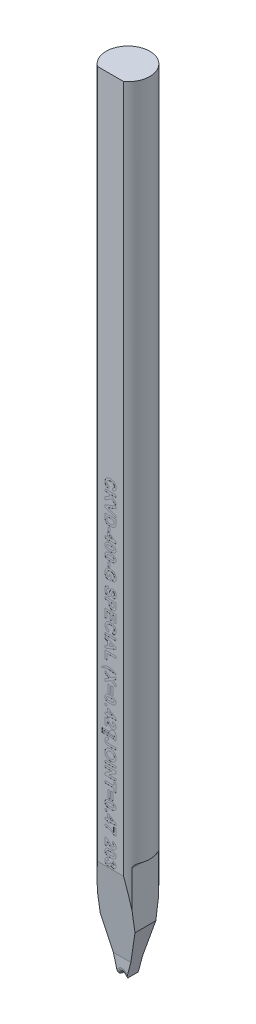
from build123d import *

# Parameters (mm, degrees)
SKETCH_TL_CUTTING_R       = 1.99771
TL_CUTTING_DEPTH          = 72.009
SKETCH_TDF_GRINDING_W     = 4.01542
SKETCH_TDF_GRINDING_H     = 4.01542
TDF_GRINDING_DEPTH        = 73.064400167
SKETCH_ENGRAVING_W        = 0.166666667
SKETCH_ENGRAVING_H        = 0.371794872
SKETCH_ENGRAVING_W_2      = 1
SKETCH_ENGRAVING_H_2      = 0.192307693
SKETCH_ENGRAVING_H_3      = 0.692307692
SKETCH_ENGRAVING_W_3      = 0.192307692
SKETCH_ENGRAVING_H_4      = 0.192307692
ENGRAVING_DEPTH           = 0.005
VW_VR_GRINDING_DEPTH      = 2.00771
VW_VR_GRINDING_DEPTH_BACK = 2.00771
ISA_GRINDING_DEPTH        = 2.00771
ISA_GRINDING_DEPTH_BACK   = 2.00771
PRE_FRX_BRX_DEPTH         = 2.00771
PRE_FRX_BRX_DEPTH_BACK    = 2.00771
SKETCH_PRE_FRX_BRX_W      = 1.46796
SKETCH_PRE_FRX_BRX_H      = 1.4986
FR_EDM_R                  = 0.39878
BR_EDM_R                  = 0.20066
FA_BA_GRINDING_DEPTH      = 2.00771
FA_BA_GRINDING_DEPTH_BACK = 2.00771


with BuildPart() as part:
    # sketch_TL_cutting → TL_cutting (new body)
    with BuildSketch(Plane(origin=(0, 0, 0), x_dir=(1, 0, 0), z_dir=(0, 1, 0))):
        Circle(SKETCH_TL_CUTTING_R)
    extrude(amount=TL_CUTTING_DEPTH)

    # sketch_TDF_grinding → TDF_grinding (cut, through all)
    with BuildSketch(Plane(origin=(0, 0, 0), x_dir=(1, 0, 0), z_dir=(0, 1, 0))):
        with Locations((0, -3.60918)):
            Rectangle(SKETCH_TDF_GRINDING_W, SKETCH_TDF_GRINDING_H)
    extrude(amount=TDF_GRINDING_DEPTH, mode=Mode.SUBTRACT)

    # sketch_engraving → engraving (cut)
    # profile 1 of 45: a face of its own
    with BuildSketch(Plane.XY.offset(1.60147)):
        with BuildLine():
            Line((-0.128205128, 39.265410256), (-0.192307692, 39.073102564))
            add(Edge.make_bspline(
                [(-0.192307692, 39.073102564), (-0.204917923, 39.077009052), (-0.229612721, 39.084659184), (-0.2649877, 39.098737804), (-0.297871332, 39.114732008), (-0.328259475, 39.132559875), (-0.356049464, 39.152295258), (-0.381471598, 39.173789244), (-0.404368127, 39.197253424), (-0.424673345, 39.222670624), (-0.442633936, 39.249763711), (-0.457816548, 39.278856053), (-0.470893242, 39.30951117), (-0.481488041, 39.342040557), (-0.489972889, 39.376228151), (-0.495577171, 39.412234413), (-0.499377062, 39.449890896), (-0.499789062, 39.475603283), (-0.5, 39.488767628)],
                knots=[0, 0, 0, 0, 1.126670901, 2.206376047, 3.246533763, 4.245677351, 5.210506282, 6.152793389, 7.083980095, 8.004497442, 8.926231833, 9.854395169, 10.801995143, 11.768203916, 12.771938831, 13.805609698, 14.87650608, 16, 16, 16, 16], degree=3))
            add(Edge.make_bspline(
                [(-0.5, 39.488767628), (-0.499663994, 39.505016309), (-0.499003061, 39.536977949), (-0.492350465, 39.583719052), (-0.481969511, 39.628260328), (-0.467601869, 39.670669613), (-0.448555271, 39.710648786), (-0.42571373, 39.748573108), (-0.398318662, 39.784009391), (-0.367249987, 39.817150716), (-0.332452821, 39.847279196), (-0.294134751, 39.873272297), (-0.253074131, 39.895810491), (-0.208709772, 39.913736594), (-0.161353037, 39.927821791), (-0.110975156, 39.937668328), (-0.057578507, 39.943834942), (-0.020984357, 39.944537083), (-0.002203526, 39.944897436)],
                knots=[0, 0, 0, 0, 1.025134988, 2.016471176, 2.973446247, 3.909197306, 4.836872559, 5.763618465, 6.698581235, 7.658772073, 8.627106982, 9.597494692, 10.576422683, 11.578339294, 12.6118974, 13.690673505, 14.814808564, 16, 16, 16, 16], degree=3))
            add(Edge.make_bspline(
                [(-0.002203526, 39.944897436), (0.017576475, 39.9445292), (0.056163648, 39.943810839), (0.112313555, 39.937762878), (0.165084042, 39.927716768), (0.214577853, 39.914140058), (0.260470573, 39.895929249), (0.303160692, 39.874073909), (0.342311169, 39.847956152), (0.377833814, 39.818031091), (0.409480853, 39.784897852), (0.437377469, 39.749193428), (0.460593243, 39.710691041), (0.479896446, 39.669867336), (0.494630503, 39.626423397), (0.505304611, 39.580476602), (0.511505561, 39.532006054), (0.512376199, 39.49886808), (0.512820513, 39.481956731)],
                knots=[0, 0, 0, 0, 1.212773307, 2.365899439, 3.458117515, 4.504331001, 5.50806732, 6.480562534, 7.440239902, 8.387651817, 9.323121479, 10.245404239, 11.160468186, 12.07454208, 13.009500751, 13.96802424, 14.963018902, 16, 16, 16, 16], degree=3))
            add(Edge.make_bspline(
                [(0.512820513, 39.481956731), (0.512448361, 39.467187276), (0.511718707, 39.438229796), (0.506761415, 39.395824506), (0.498061698, 39.355636158), (0.486319015, 39.317447521), (0.470821797, 39.281475987), (0.451884357, 39.247657111), (0.429606892, 39.215874651), (0.412205553, 39.196725065), (0.403445513, 39.187084936)],
                knots=[0, 0, 0, 0, 1.098510076, 2.153775193, 3.169777012, 4.153122333, 5.120892526, 6.076995459, 7.031936742, 8, 8, 8, 8], degree=3))
            add(Edge.make_bspline(
                [(0.403445513, 39.187084936), (0.39787141, 39.181497644), (0.386592274, 39.170191818), (0.367549896, 39.155095368), (0.347050772, 39.140782058), (0.324745215, 39.127479068), (0.30046466, 39.115606849), (0.274581981, 39.104594097), (0.246997406, 39.094455069), (0.227800247, 39.088816604), (0.217948718, 39.085923077)],
                knots=[0, 0, 0, 0, 0.885292881, 1.791380647, 2.722937556, 3.69093542, 4.703306561, 5.754477758, 6.847650944, 8, 8, 8, 8], degree=3))
            Line((0.217948718, 39.085923077), (0.179487179, 39.278230769))
            add(Edge.make_bspline(
                [(0.179487179, 39.278230769), (0.1857949, 39.279865288), (0.198219456, 39.283084861), (0.21607256, 39.28959955), (0.233014714, 39.297071208), (0.248625569, 39.3063361), (0.263619506, 39.316162074), (0.277222328, 39.327824773), (0.290109132, 39.340329754), (0.301694454, 39.354218861), (0.312145605, 39.369093589), (0.321339918, 39.384803983), (0.329014435, 39.401388478), (0.335156827, 39.418721754), (0.340319842, 39.436745702), (0.34350638, 39.455632147), (0.345953545, 39.475215752), (0.3460861, 39.488558875), (0.346153846, 39.495378205)],
                knots=[0, 0, 0, 0, 1.051114734, 2.070420253, 3.064047898, 4.034553068, 4.997066449, 5.953344811, 6.921213386, 7.892675544, 8.867420182, 9.852654213, 10.826683617, 11.811917648, 12.818610352, 13.848120519, 14.900229319, 16, 16, 16, 16], degree=3))
            add(Edge.make_bspline(
                [(0.346153846, 39.495378205), (0.345958725, 39.504742256), (0.345576529, 39.52308423), (0.341532101, 39.54981448), (0.335695112, 39.575255692), (0.326982094, 39.59931706), (0.315677399, 39.621931698), (0.302244603, 39.643428905), (0.286035184, 39.663260806), (0.26758257, 39.681899764), (0.246135655, 39.698607721), (0.221779967, 39.713310652), (0.194212535, 39.725504121), (0.163711493, 39.735404409), (0.130202077, 39.743196736), (0.093641969, 39.748761162), (0.054005962, 39.751838434), (0.026581025, 39.752333903), (0.012419872, 39.752589744)],
                knots=[0, 0, 0, 0, 0.93816214, 1.837638998, 2.704791736, 3.551915875, 4.396257554, 5.235807848, 6.087970119, 6.959042444, 7.860386085, 8.80649345, 9.804409709, 10.875695391, 12.017327537, 13.250155505, 14.580089023, 16, 16, 16, 16], degree=3))
            add(Edge.make_bspline(
                [(0.012419872, 39.752589744), (-0.002609028, 39.752336423), (-0.031567402, 39.751848312), (-0.073337178, 39.748771685), (-0.111754322, 39.743171705), (-0.14688701, 39.735482849), (-0.178713725, 39.725532973), (-0.207179389, 39.713359106), (-0.23231734, 39.698886701), (-0.254110839, 39.682138275), (-0.272831387, 39.663537256), (-0.288926796, 39.643587439), (-0.302688307, 39.622406524), (-0.314010391, 39.599867053), (-0.322575422, 39.575883298), (-0.328786932, 39.550652371), (-0.332735688, 39.524081695), (-0.333131326, 39.505875799), (-0.333333333, 39.496580128)],
                knots=[0, 0, 0, 0, 1.475208372, 2.842499301, 4.107722225, 5.282836115, 6.369007568, 7.375918121, 8.315702116, 9.208439171, 10.065831443, 10.90006451, 11.71996243, 12.54067204, 13.369972975, 14.214060185, 15.088124569, 16, 16, 16, 16], degree=3))
            add(Edge.make_bspline(
                [(-0.333333333, 39.496580128), (-0.333161634, 39.489697953), (-0.332824013, 39.476165176), (-0.330681155, 39.456162689), (-0.326591822, 39.43696438), (-0.321184418, 39.418476281), (-0.314399721, 39.400626559), (-0.305696319, 39.38368748), (-0.295693052, 39.367325777), (-0.283969989, 39.35188094), (-0.270808612, 39.337146156), (-0.255597341, 39.323707159), (-0.238701667, 39.311241373), (-0.220008678, 39.299906947), (-0.199678377, 39.28932516), (-0.177394008, 39.280322121), (-0.153515697, 39.271934984), (-0.136789345, 39.267623153), (-0.128205128, 39.265410256)],
                knots=[0, 0, 0, 0, 0.980177776, 1.927374078, 2.859849964, 3.771585772, 4.668674471, 5.574490016, 6.479656464, 7.396337719, 8.332153134, 9.288470092, 10.28125149, 11.318486971, 12.398724812, 13.541284404, 14.738150009, 16, 16, 16, 16], degree=3))
        make_face()
    # profile 2 of 45: a face of its own
    with BuildSketch(Plane.XY.offset(1.60147)):
        Polygon((-0.5, 38.906435897), (0.5, 38.906435897), (0.5, 38.714128205), (0.052283654, 38.714128205), (0.5, 38.292453526), (0.5, 38.028230769), (0.11338141, 38.408038462), (-0.5, 38.015410256), (-0.5, 38.271620192), (-0.035456731, 38.553871795), (-0.198517628, 38.714128205), (-0.5, 38.714128205), align=None)
    # profile 3 of 45: a face of its own
    with BuildSketch(Plane.XY.offset(1.60147)):
        Polygon((-0.5, 37.639208333), (0.5, 38.009), (0.5, 37.805875), (-0.243589744, 37.541051282), (0.5, 37.277229167), (0.5, 37.073102564), (-0.5, 37.441491987), align=None)
    # profile 4 of 45: a face of its own
    with BuildSketch(Plane.XY.offset(1.60147)):
        with BuildLine():
            Line((0.5, 36.983358974), (0.5, 36.616572115))
            add(Edge.make_bspline(
                [(0.5, 36.616572115), (0.500005193, 36.606554571), (0.500015306, 36.587048084), (0.498840892, 36.558739066), (0.497659587, 36.532266494), (0.495294873, 36.507706352), (0.492816233, 36.484973432), (0.489678088, 36.464026942), (0.485656212, 36.444999202), (0.482484481, 36.433000319), (0.480969551, 36.427269231)],
                knots=[0, 0, 0, 0, 1.259756885, 2.453039283, 3.563158368, 4.591894114, 5.55549294, 6.43918076, 7.254497783, 8, 8, 8, 8], degree=3))
            add(Edge.make_bspline(
                [(0.480969551, 36.427269231), (0.478637325, 36.420100254), (0.474014881, 36.405891431), (0.465827813, 36.385038378), (0.455960096, 36.365204479), (0.445111978, 36.345929819), (0.432903728, 36.327657553), (0.419595761, 36.309942873), (0.404753223, 36.293309803), (0.383633179, 36.27177514), (0.35420815, 36.247350255), (0.315375005, 36.22151972), (0.272594656, 36.199782014), (0.234409605, 36.184590641), (0.20183843, 36.174546542), (0.175754603, 36.167978141), (0.148301213, 36.162306468), (0.119383738, 36.158056292), (0.08913491, 36.154394906), (0.057465542, 36.151767238), (0.024383276, 36.15046625), (0.001870575, 36.150174494), (-0.009615385, 36.150025641)],
                knots=[0, 0, 0, 0, 0.745431882, 1.477436776, 2.212739876, 2.934276521, 3.663147754, 4.384200836, 5.123377481, 5.865761747, 7.365547505, 8.894711587, 10.468722596, 12.101948761, 12.951987285, 13.837595333, 14.760899389, 15.722756883, 16.726861385, 17.773652936, 18.864119771, 20, 20, 20, 20], degree=3))
            add(Edge.make_bspline(
                [(-0.009615385, 36.150025641), (-0.0294616, 36.150417046), (-0.067834928, 36.15117384), (-0.123301552, 36.156771211), (-0.17465514, 36.166066648), (-0.206804138, 36.175777075), (-0.222355769, 36.180474359)],
                knots=[0, 0, 0, 0, 1.103491527, 2.133638164, 3.0971734, 4, 4, 4, 4], degree=3))
            add(Edge.make_bspline(
                [(-0.222355769, 36.180474359), (-0.231274521, 36.183648003), (-0.248819098, 36.189891057), (-0.274127236, 36.200815932), (-0.298211673, 36.212620337), (-0.321053432, 36.225402184), (-0.342549771, 36.239226052), (-0.362636394, 36.254143645), (-0.381577746, 36.269923731), (-0.393236239, 36.28135549), (-0.399038462, 36.287044872)],
                knots=[0, 0, 0, 0, 1.090884612, 2.145940218, 3.175104604, 4.181306866, 5.161203701, 6.118658341, 7.063689906, 8, 8, 8, 8], degree=3))
            add(Edge.make_bspline(
                [(-0.399038462, 36.287044872), (-0.407300305, 36.296331145), (-0.424264154, 36.315398431), (-0.445652736, 36.34874995), (-0.464086504, 36.386625276), (-0.473760833, 36.413939168), (-0.478766026, 36.428070513)],
                knots=[0, 0, 0, 0, 0.912008655, 1.872605891, 2.89935344, 4, 4, 4, 4], degree=3))
            add(Edge.make_bspline(
                [(-0.478766026, 36.428070513), (-0.4805228, 36.433790486), (-0.484168894, 36.445661996), (-0.488062998, 36.464485444), (-0.492165475, 36.484579947), (-0.49463687, 36.506177223), (-0.497243066, 36.529053081), (-0.498706299, 36.553389822), (-0.49974511, 36.579103081), (-0.499913777, 36.596739175), (-0.5, 36.605754808)],
                knots=[0, 0, 0, 0, 0.799129865, 1.658552685, 2.566799617, 3.538529252, 4.561352959, 5.643373779, 6.795284424, 8, 8, 8, 8], degree=3))
            Line((-0.5, 36.605754808), (-0.5, 36.983358974))
            Line((-0.5, 36.983358974), (0.5, 36.983358974))
        make_face()
        with BuildLine():
            Line((0.333333333, 36.791051282), (-0.333333333, 36.791051282))
            Line((-0.333333333, 36.791051282), (-0.333333333, 36.632798077))
            add(Edge.make_bspline(
                [(-0.333333333, 36.632798077), (-0.333276671, 36.62565336), (-0.333167574, 36.611897049), (-0.332847006, 36.591991316), (-0.331979167, 36.573698115), (-0.331080228, 36.556921614), (-0.329595022, 36.54170549), (-0.328134266, 36.527983535), (-0.326090699, 36.515832132), (-0.324477534, 36.508327127), (-0.323717949, 36.504793269)],
                knots=[0, 0, 0, 0, 1.333384787, 2.567275092, 3.714769766, 4.750907381, 5.701951617, 6.567520054, 7.325492842, 8, 8, 8, 8], degree=3))
            add(Edge.make_bspline(
                [(-0.323717949, 36.504793269), (-0.321509316, 36.496516575), (-0.317207482, 36.480395757), (-0.307617456, 36.457760499), (-0.296048139, 36.437278507), (-0.282136533, 36.41860677), (-0.26455548, 36.40177967), (-0.242070693, 36.387415683), (-0.215254411, 36.374122192), (-0.189584523, 36.365018806), (-0.16665678, 36.358484413), (-0.147412959, 36.354061165), (-0.126593091, 36.350565591), (-0.104279343, 36.347558942), (-0.080500412, 36.345129499), (-0.055170426, 36.343617784), (-0.028320392, 36.342586029), (-0.009883527, 36.342419161), (-0.000400641, 36.342333333)],
                knots=[0, 0, 0, 0, 1.038686998, 2.023088296, 2.974059649, 3.888265163, 4.839857954, 5.909819677, 7.113156087, 8.466843969, 9.20827164, 10.006482943, 10.861893492, 11.769681931, 12.739021491, 13.762258324, 14.849031541, 16, 16, 16, 16], degree=3))
            add(Edge.make_bspline(
                [(-0.000400641, 36.342333333), (0.009082275, 36.3424185), (0.027452469, 36.342583485), (0.054102292, 36.343613664), (0.079033415, 36.345116863), (0.102276578, 36.347563691), (0.123864169, 36.350523456), (0.143813574, 36.354060891), (0.161996804, 36.358454423), (0.183589283, 36.365007511), (0.207947697, 36.374844996), (0.23429421, 36.388671199), (0.2571147, 36.404936402), (0.276689574, 36.423291558), (0.29287817, 36.444378569), (0.306422028, 36.467749371), (0.316938162, 36.493880279), (0.321416742, 36.512469318), (0.323717949, 36.522020833)],
                knots=[0, 0, 0, 0, 1.118059345, 2.165891593, 3.144157881, 4.062285166, 4.920717571, 5.712910489, 6.449981617, 7.12489426, 8.371943983, 9.541298068, 10.624898781, 11.666293176, 12.69306237, 13.747704633, 14.842713931, 16, 16, 16, 16], degree=3))
            add(Edge.make_bspline(
                [(0.323717949, 36.522020833), (0.324486218, 36.526155143), (0.326177652, 36.535257311), (0.328151987, 36.550361571), (0.329628909, 36.568148179), (0.331099472, 36.588577116), (0.331977905, 36.611627064), (0.332859431, 36.637332571), (0.333166326, 36.665716851), (0.333276065, 36.685549207), (0.333333333, 36.695899038)],
                knots=[0, 0, 0, 0, 0.578739524, 1.274162912, 2.095457587, 3.035141998, 4.093102578, 5.270121571, 6.575369351, 8, 8, 8, 8], degree=3))
            Line((0.333333333, 36.695899038), (0.333333333, 36.791051282))
        make_face(mode=Mode.SUBTRACT)
    # profile 5 of 45: a face of its own
    with BuildSketch(Plane.XY.offset(1.60147)):
        with Locations((-0.147435898, 35.823102564)):
            Rectangle(SKETCH_ENGRAVING_W, SKETCH_ENGRAVING_H)
    # profile 6 of 45: a face of its own
    with BuildSketch(Plane.XY.offset(1.60147)):
        Polygon((-0.5, 35.201307692), (-0.294871795, 35.201307692), (-0.294871795, 35.59874359), (-0.12880609, 35.59874359), (0.487179487, 35.175866987), (0.487179487, 35.009), (-0.128205128, 35.009), (-0.128205128, 34.880794872), (-0.294871795, 34.880794872), (-0.294871795, 35.009), (-0.5, 35.009), align=None)
        Polygon((-0.128205128, 35.201307692), (0.204727564, 35.201307692), (-0.128205128, 35.430073718), align=None, mode=Mode.SUBTRACT)
    # profile 7 of 45: a face of its own
    with BuildSketch(Plane.XY.offset(1.60147)):
        with BuildLine():
            add(Edge.make_bspline(
                [(0.5, 34.476948718), (0.49971384, 34.465044998), (0.499156721, 34.441869821), (0.494192381, 34.408107508), (0.486315205, 34.376354925), (0.474936732, 34.346605943), (0.460535804, 34.318709267), (0.442472771, 34.293057415), (0.421624591, 34.26905643), (0.405435577, 34.255200797), (0.397235577, 34.248182692)],
                knots=[0, 0, 0, 0, 1.098626248, 2.138899374, 3.143835643, 4.113754749, 5.073488057, 6.034745239, 7.004566348, 8, 8, 8, 8], degree=3))
            add(Edge.make_bspline(
                [(0.397235577, 34.248182692), (0.392013767, 34.244167993), (0.381356969, 34.235974695), (0.364136726, 34.22494029), (0.345869985, 34.214331685), (0.326116385, 34.205073442), (0.305221356, 34.196200078), (0.283126793, 34.188009313), (0.259707844, 34.18077695), (0.235071142, 34.174472124), (0.209179241, 34.168578627), (0.181968999, 34.163641398), (0.15350924, 34.159415972), (0.123831018, 34.156120738), (0.092992495, 34.153166339), (0.060842825, 34.151549757), (0.027454838, 34.150225267), (0.004742429, 34.150092949), (-0.006810897, 34.150025641)],
                knots=[0, 0, 0, 0, 0.746775751, 1.524038446, 2.317840886, 3.141016509, 3.996283186, 4.892488336, 5.812382473, 6.774967264, 7.776368117, 8.823659909, 9.910833035, 11.039122168, 12.210293276, 13.424012874, 14.68964937, 16, 16, 16, 16], degree=3))
            add(Edge.make_bspline(
                [(-0.006810897, 34.150025641), (-0.01836425, 34.150091934), (-0.041009977, 34.150221876), (-0.074330982, 34.151554693), (-0.106413621, 34.153167781), (-0.13725379, 34.156113853), (-0.166926114, 34.159440728), (-0.195353975, 34.163546272), (-0.22243919, 34.168864764), (-0.248289812, 34.174671418), (-0.27303117, 34.180936077), (-0.296407841, 34.1884899), (-0.318777777, 34.196350303), (-0.339699687, 34.205429898), (-0.359477735, 34.215020372), (-0.377930928, 34.225471112), (-0.395257891, 34.236628726), (-0.40597091, 34.244901289), (-0.411258013, 34.248983974)],
                knots=[0, 0, 0, 0, 1.308411734, 2.564617834, 3.776541518, 4.94597967, 6.0725993, 7.15816376, 8.197872509, 9.197791611, 10.158952087, 11.086962723, 11.979249638, 12.843171697, 13.668427753, 14.467630577, 15.243743175, 16, 16, 16, 16], degree=3))
            add(Edge.make_bspline(
                [(-0.411258013, 34.248983974), (-0.419387722, 34.255937875), (-0.435436162, 34.269665209), (-0.456111536, 34.293400465), (-0.473801555, 34.3190109), (-0.487914093, 34.346857064), (-0.499368982, 34.376461236), (-0.506993451, 34.408265546), (-0.511967929, 34.441935616), (-0.512532265, 34.465111213), (-0.512820513, 34.476948718)],
                knots=[0, 0, 0, 0, 0.991667276, 1.957599061, 2.911530233, 3.873218945, 4.847995157, 5.850445929, 6.902062539, 8, 8, 8, 8], degree=3))
            add(Edge.make_bspline(
                [(-0.512820513, 34.476948718), (-0.512476011, 34.488921133), (-0.511800941, 34.512381702), (-0.506449472, 34.546635149), (-0.497876451, 34.579194622), (-0.485636462, 34.609943234), (-0.469774335, 34.638836989), (-0.45076002, 34.666101616), (-0.427732542, 34.691143948), (-0.40629523, 34.710749361), (-0.386925042, 34.725092741), (-0.37086259, 34.735209036), (-0.353675124, 34.744985358), (-0.33482528, 34.753423499), (-0.314870578, 34.761748475), (-0.293380967, 34.769121787), (-0.270541238, 34.775626959), (-0.246455682, 34.781734901), (-0.220958398, 34.786828025), (-0.194124629, 34.791512952), (-0.165840258, 34.795204927), (-0.136262825, 34.798478243), (-0.105322509, 34.800782844), (-0.073069943, 34.802654475), (-0.039401887, 34.803592969), (-0.01649349, 34.803777608), (-0.004807692, 34.803871795)],
                knots=[0, 0, 0, 0, 1.257818097, 2.464759732, 3.634271214, 4.790227596, 5.933394726, 7.09190477, 8.274482889, 9.50191983, 10.139172818, 10.805000628, 11.49619854, 12.215266328, 12.973768034, 13.768328009, 14.601232062, 15.469317089, 16.379095881, 17.333267023, 18.331755967, 19.376479622, 20.460535752, 21.592206075, 22.771760786, 24, 24, 24, 24], degree=3))
            add(Edge.make_bspline(
                [(-0.004807692, 34.803871795), (0.006678925, 34.803806), (0.02919122, 34.803677052), (0.062378132, 34.802334948), (0.094328674, 34.800741634), (0.12509981, 34.79776902), (0.154640959, 34.794469515), (0.183004063, 34.790356894), (0.209982531, 34.784938814), (0.235876189, 34.779589743), (0.260431507, 34.772849782), (0.2837906, 34.765424475), (0.306110518, 34.757590136), (0.326924245, 34.748417854), (0.346659803, 34.738882898), (0.365109758, 34.728424838), (0.382437536, 34.717269066), (0.39315045, 34.708996265), (0.3984375, 34.704913462)],
                knots=[0, 0, 0, 0, 1.304443357, 2.556541329, 3.771813033, 4.936929721, 6.066661712, 7.147723817, 8.190304831, 9.191350322, 10.149780912, 11.080355239, 11.975107155, 12.834450748, 13.66198663, 14.463397305, 15.241653965, 16, 16, 16, 16], degree=3))
            add(Edge.make_bspline(
                [(0.3984375, 34.704913462), (0.406566428, 34.697959179), (0.422613323, 34.684231089), (0.443299998, 34.660501361), (0.460913987, 34.634919209), (0.475197493, 34.607154301), (0.486497465, 34.577482107), (0.494183265, 34.545636121), (0.499144648, 34.511960686), (0.499710816, 34.488785839), (0.5, 34.476948718)],
                knots=[0, 0, 0, 0, 0.991631672, 1.957528776, 2.911425699, 3.867574088, 4.848108326, 5.850523106, 6.902101959, 8, 8, 8, 8], degree=3))
        make_face()
        with BuildLine():
            add(Edge.make_bspline(
                [(0.333333333, 34.476948718), (0.333068079, 34.483116684), (0.332548986, 34.495187158), (0.328316127, 34.512742094), (0.321759633, 34.529323165), (0.312130705, 34.544881206), (0.299093083, 34.55928978), (0.281476094, 34.571497658), (0.259881539, 34.582051162), (0.243736, 34.587330771), (0.235176282, 34.590129808)],
                knots=[0, 0, 0, 0, 0.909107913, 1.77908945, 2.650019014, 3.530482969, 4.465025013, 5.495890128, 6.672421267, 8, 8, 8, 8], degree=3))
            add(Edge.make_bspline(
                [(0.235176282, 34.590129808), (0.228718042, 34.591877997), (0.214837576, 34.595635317), (0.192206647, 34.59989972), (0.166522939, 34.603416485), (0.137792419, 34.606386038), (0.105999886, 34.608802628), (0.071125109, 34.610290848), (0.033192525, 34.611319478), (0.006878451, 34.611480391), (-0.006810897, 34.611564103)],
                knots=[0, 0, 0, 0, 0.658986521, 1.416336438, 2.266694271, 3.212608458, 4.261595115, 5.407496572, 6.651304179, 8, 8, 8, 8], degree=3))
            add(Edge.make_bspline(
                [(-0.006810897, 34.611564103), (-0.020433943, 34.611573117), (-0.046549094, 34.611590397), (-0.084006477, 34.610416163), (-0.118154033, 34.60924872), (-0.148991056, 34.606879061), (-0.176626244, 34.604540892), (-0.200847568, 34.601003343), (-0.221857789, 34.597450608), (-0.244486895, 34.591417153), (-0.268257705, 34.583101394), (-0.292448985, 34.571872977), (-0.311537375, 34.559207058), (-0.325415776, 34.544675587), (-0.334597404, 34.528930329), (-0.341538269, 34.512626395), (-0.345246665, 34.495074555), (-0.345848983, 34.483040013), (-0.346153846, 34.476948718)],
                knots=[0, 0, 0, 0, 1.613038927, 3.092168624, 4.43749063, 5.658264602, 6.75425577, 7.720394221, 8.556328411, 9.275513998, 10.490872946, 11.534172084, 12.42681833, 13.187531851, 13.88996177, 14.574222125, 15.278341114, 16, 16, 16, 16], degree=3))
            add(Edge.make_bspline(
                [(-0.346153846, 34.476948718), (-0.345874419, 34.47085088), (-0.345321688, 34.458788799), (-0.341225408, 34.441256833), (-0.334465655, 34.424699336), (-0.325029126, 34.409036493), (-0.311901617, 34.39461441), (-0.294300445, 34.382397614), (-0.272700888, 34.37184693), (-0.25655611, 34.366566893), (-0.247996795, 34.363767628)],
                knots=[0, 0, 0, 0, 0.899391665, 1.779078861, 2.640979247, 3.529945348, 4.464599804, 5.495588918, 6.672261578, 8, 8, 8, 8], degree=3))
            add(Edge.make_bspline(
                [(-0.247996795, 34.363767628), (-0.241538043, 34.362021968), (-0.227719754, 34.358287186), (-0.205229709, 34.353992396), (-0.179679092, 34.35046611), (-0.151079269, 34.347524791), (-0.11935541, 34.345084431), (-0.084546407, 34.343608845), (-0.046680798, 34.342579247), (-0.020433482, 34.342417356), (-0.006810897, 34.342333333)],
                knots=[0, 0, 0, 0, 0.66114423, 1.414496391, 2.261103113, 3.210114492, 4.255954433, 5.405607896, 6.653488082, 8, 8, 8, 8], degree=3))
            add(Edge.make_bspline(
                [(-0.006810897, 34.342333333), (0.006810741, 34.342447109), (0.032921137, 34.342665199), (0.070464093, 34.343292091), (0.104645163, 34.345047006), (0.13553417, 34.346803226), (0.163028833, 34.349768631), (0.187277888, 34.352711537), (0.208178651, 34.356783667), (0.23096624, 34.362375697), (0.254848985, 34.37071368), (0.278913284, 34.38228584), (0.298191428, 34.39472291), (0.312146257, 34.409229879), (0.321683592, 34.424948044), (0.328364426, 34.441400374), (0.332523972, 34.458849531), (0.333060584, 34.47084941), (0.333333333, 34.476948718)],
                knots=[0, 0, 0, 0, 1.611458614, 3.088895909, 4.441089836, 5.660086535, 6.747875232, 7.711965119, 8.548505902, 9.26500436, 10.486583113, 11.532259092, 12.419544583, 13.184925779, 13.890764661, 14.581638641, 15.279074115, 16, 16, 16, 16], degree=3))
        make_face(mode=Mode.SUBTRACT)
    # profile 8 of 45: a face of its own
    with BuildSketch(Plane.XY.offset(1.60147)):
        with BuildLine():
            add(Edge.make_bspline(
                [(0.5, 33.707717949), (0.49971384, 33.695814229), (0.499156721, 33.672639051), (0.494192381, 33.638876739), (0.486315205, 33.607124156), (0.474936732, 33.577375173), (0.460535804, 33.549478497), (0.442472771, 33.523826646), (0.421624591, 33.499825661), (0.405435577, 33.485970028), (0.397235577, 33.478951923)],
                knots=[0, 0, 0, 0, 1.098626248, 2.138899374, 3.143835643, 4.113754749, 5.073488057, 6.034745239, 7.004566348, 8, 8, 8, 8], degree=3))
            add(Edge.make_bspline(
                [(0.397235577, 33.478951923), (0.392013767, 33.474937224), (0.381356969, 33.466743926), (0.364136726, 33.45570952), (0.345869985, 33.445100915), (0.326116385, 33.435842673), (0.305221356, 33.426969309), (0.283126793, 33.418778544), (0.259707844, 33.41154618), (0.235071142, 33.405241354), (0.209179241, 33.399347858), (0.181968999, 33.394410628), (0.15350924, 33.390185203), (0.123831018, 33.386889969), (0.092992495, 33.38393557), (0.060842825, 33.382318988), (0.027454838, 33.380994498), (0.004742429, 33.380862179), (-0.006810897, 33.380794872)],
                knots=[0, 0, 0, 0, 0.746775751, 1.524038446, 2.317840886, 3.141016509, 3.996283186, 4.892488336, 5.812382473, 6.774967264, 7.776368117, 8.823659909, 9.910833035, 11.039122168, 12.210293276, 13.424012874, 14.68964937, 16, 16, 16, 16], degree=3))
            add(Edge.make_bspline(
                [(-0.006810897, 33.380794872), (-0.01836425, 33.380861165), (-0.041009977, 33.380991107), (-0.074330982, 33.382323924), (-0.106413621, 33.383937012), (-0.13725379, 33.386883084), (-0.166926114, 33.390209959), (-0.195353975, 33.394315503), (-0.22243919, 33.399633995), (-0.248289812, 33.405440649), (-0.27303117, 33.411705308), (-0.296407841, 33.419259131), (-0.318777777, 33.427119533), (-0.339699687, 33.436199129), (-0.359477735, 33.445789602), (-0.377930928, 33.456240342), (-0.395257891, 33.467397957), (-0.40597091, 33.47567052), (-0.411258013, 33.479753205)],
                knots=[0, 0, 0, 0, 1.308411734, 2.564617834, 3.776541518, 4.94597967, 6.0725993, 7.15816376, 8.197872509, 9.197791611, 10.158952087, 11.086962723, 11.979249638, 12.843171697, 13.668427753, 14.467630577, 15.243743175, 16, 16, 16, 16], degree=3))
            add(Edge.make_bspline(
                [(-0.411258013, 33.479753205), (-0.419387722, 33.486707105), (-0.435436162, 33.50043444), (-0.456111536, 33.524169695), (-0.473801555, 33.549780131), (-0.487914093, 33.577626295), (-0.499368982, 33.607230467), (-0.506993451, 33.639034777), (-0.511967929, 33.672704847), (-0.512532265, 33.695880444), (-0.512820513, 33.707717949)],
                knots=[0, 0, 0, 0, 0.991667276, 1.957599061, 2.911530233, 3.873218945, 4.847995157, 5.850445929, 6.902062539, 8, 8, 8, 8], degree=3))
            add(Edge.make_bspline(
                [(-0.512820513, 33.707717949), (-0.512476011, 33.719690364), (-0.511800941, 33.743150933), (-0.506449472, 33.777404379), (-0.497876451, 33.809963853), (-0.485636462, 33.840712465), (-0.469774335, 33.86960622), (-0.45076002, 33.896870847), (-0.427732542, 33.921913179), (-0.40629523, 33.941518592), (-0.386925042, 33.955861971), (-0.37086259, 33.965978267), (-0.353675124, 33.975754589), (-0.33482528, 33.98419273), (-0.314870578, 33.992517706), (-0.293380967, 33.999891018), (-0.270541238, 34.00639619), (-0.246455682, 34.012504132), (-0.220958398, 34.017597256), (-0.194124629, 34.022282183), (-0.165840258, 34.025974157), (-0.136262825, 34.029247473), (-0.105322509, 34.031552075), (-0.073069943, 34.033423706), (-0.039401887, 34.0343622), (-0.01649349, 34.034546839), (-0.004807692, 34.034641026)],
                knots=[0, 0, 0, 0, 1.257818097, 2.464759732, 3.634271214, 4.790227596, 5.933394726, 7.09190477, 8.274482889, 9.50191983, 10.139172818, 10.805000628, 11.49619854, 12.215266328, 12.973768034, 13.768328009, 14.601232062, 15.469317089, 16.379095881, 17.333267023, 18.331755967, 19.376479622, 20.460535752, 21.592206075, 22.771760786, 24, 24, 24, 24], degree=3))
            add(Edge.make_bspline(
                [(-0.004807692, 34.034641026), (0.006678925, 34.034575231), (0.02919122, 34.034446282), (0.062378132, 34.033104179), (0.094328674, 34.031510865), (0.12509981, 34.028538251), (0.154640959, 34.025238746), (0.183004063, 34.021126125), (0.209982531, 34.015708045), (0.235876189, 34.010358974), (0.260431507, 34.003619013), (0.2837906, 33.996193706), (0.306110518, 33.988359367), (0.326924245, 33.979187084), (0.346659803, 33.969652128), (0.365109758, 33.959194069), (0.382437536, 33.948038297), (0.39315045, 33.939765495), (0.3984375, 33.935682692)],
                knots=[0, 0, 0, 0, 1.304443357, 2.556541329, 3.771813033, 4.936929721, 6.066661712, 7.147723817, 8.190304831, 9.191350322, 10.149780912, 11.080355239, 11.975107155, 12.834450748, 13.66198663, 14.463397305, 15.241653965, 16, 16, 16, 16], degree=3))
            add(Edge.make_bspline(
                [(0.3984375, 33.935682692), (0.406566428, 33.92872841), (0.422613323, 33.91500032), (0.443299998, 33.891270592), (0.460913987, 33.865688439), (0.475197493, 33.837923532), (0.486497465, 33.808251338), (0.494183265, 33.776405352), (0.499144648, 33.742729916), (0.499710816, 33.71955507), (0.5, 33.707717949)],
                knots=[0, 0, 0, 0, 0.991631672, 1.957528776, 2.911425699, 3.867574088, 4.848108326, 5.850523106, 6.902101959, 8, 8, 8, 8], degree=3))
        make_face()
        with BuildLine():
            add(Edge.make_bspline(
                [(0.333333333, 33.707717949), (0.333068079, 33.713885915), (0.332548986, 33.725956389), (0.328316127, 33.743511325), (0.321759633, 33.760092396), (0.312130705, 33.775650436), (0.299093083, 33.790059011), (0.281476094, 33.802266888), (0.259881539, 33.812820392), (0.243736, 33.818100001), (0.235176282, 33.820899038)],
                knots=[0, 0, 0, 0, 0.909107913, 1.77908945, 2.650019014, 3.530482969, 4.465025013, 5.495890128, 6.672421267, 8, 8, 8, 8], degree=3))
            add(Edge.make_bspline(
                [(0.235176282, 33.820899038), (0.228718042, 33.822647227), (0.214837576, 33.826404548), (0.192206647, 33.830668951), (0.166522939, 33.834185716), (0.137792419, 33.837155269), (0.105999886, 33.839571859), (0.071125109, 33.841060078), (0.033192525, 33.842088709), (0.006878451, 33.842249622), (-0.006810897, 33.842333333)],
                knots=[0, 0, 0, 0, 0.658986521, 1.416336438, 2.266694271, 3.212608458, 4.261595115, 5.407496572, 6.651304179, 8, 8, 8, 8], degree=3))
            add(Edge.make_bspline(
                [(-0.006810897, 33.842333333), (-0.020433943, 33.842342347), (-0.046549094, 33.842359627), (-0.084006477, 33.841185394), (-0.118154033, 33.840017951), (-0.148991056, 33.837648292), (-0.176626244, 33.835310123), (-0.200847568, 33.831772574), (-0.221857789, 33.828219839), (-0.244486895, 33.822186384), (-0.268257705, 33.813870625), (-0.292448985, 33.802642207), (-0.311537375, 33.789976289), (-0.325415776, 33.775444818), (-0.334597404, 33.75969956), (-0.341538269, 33.743395625), (-0.345246665, 33.725843786), (-0.345848983, 33.713809244), (-0.346153846, 33.707717949)],
                knots=[0, 0, 0, 0, 1.613038927, 3.092168624, 4.43749063, 5.658264602, 6.75425577, 7.720394221, 8.556328411, 9.275513998, 10.490872946, 11.534172084, 12.42681833, 13.187531851, 13.88996177, 14.574222125, 15.278341114, 16, 16, 16, 16], degree=3))
            add(Edge.make_bspline(
                [(-0.346153846, 33.707717949), (-0.345874419, 33.701620111), (-0.345321688, 33.68955803), (-0.341225408, 33.672026063), (-0.334465655, 33.655468567), (-0.325029126, 33.639805723), (-0.311901617, 33.625383641), (-0.294300445, 33.613166845), (-0.272700888, 33.602616161), (-0.25655611, 33.597336123), (-0.247996795, 33.594536859)],
                knots=[0, 0, 0, 0, 0.899391665, 1.779078861, 2.640979247, 3.529945348, 4.464599804, 5.495588918, 6.672261578, 8, 8, 8, 8], degree=3))
            add(Edge.make_bspline(
                [(-0.247996795, 33.594536859), (-0.241538043, 33.592791199), (-0.227719754, 33.589056417), (-0.205229709, 33.584761627), (-0.179679092, 33.58123534), (-0.151079269, 33.578294022), (-0.11935541, 33.575853662), (-0.084546407, 33.574378076), (-0.046680798, 33.573348478), (-0.020433482, 33.573186587), (-0.006810897, 33.573102564)],
                knots=[0, 0, 0, 0, 0.66114423, 1.414496391, 2.261103113, 3.210114492, 4.255954433, 5.405607896, 6.653488082, 8, 8, 8, 8], degree=3))
            add(Edge.make_bspline(
                [(-0.006810897, 33.573102564), (0.006810741, 33.57321634), (0.032921137, 33.57343443), (0.070464093, 33.574061322), (0.104645163, 33.575816237), (0.13553417, 33.577572457), (0.163028833, 33.580537861), (0.187277888, 33.583480768), (0.208178651, 33.587552897), (0.23096624, 33.593144928), (0.254848985, 33.60148291), (0.278913284, 33.613055071), (0.298191428, 33.625492141), (0.312146257, 33.63999911), (0.321683592, 33.655717274), (0.328364426, 33.672169605), (0.332523972, 33.689618762), (0.333060584, 33.701618641), (0.333333333, 33.707717949)],
                knots=[0, 0, 0, 0, 1.611458614, 3.088895909, 4.441089836, 5.660086535, 6.747875232, 7.711965119, 8.548505902, 9.26500436, 10.486583113, 11.532259092, 12.419544583, 13.184925779, 13.890764661, 14.581638641, 15.279074115, 16, 16, 16, 16], degree=3))
        make_face(mode=Mode.SUBTRACT)
    # profile 9 of 45: a face of its own
    with BuildSketch(Plane.XY.offset(1.60147)):
        with Locations((-0.147435898, 33.053871795)):
            Rectangle(SKETCH_ENGRAVING_W, SKETCH_ENGRAVING_H)
    # profile 10 of 45: a face of its own
    with BuildSketch(Plane.XY.offset(1.60147)):
        with BuildLine():
            Line((-0.128205128, 32.303871795), (0.038461538, 32.303871795))
            Line((0.038461538, 32.303871795), (0.038461538, 31.867974359))
            Line((0.038461538, 31.867974359), (-0.36338141, 31.867974359))
            add(Edge.make_bspline(
                [(-0.36338141, 31.867974359), (-0.368321434, 31.873460375), (-0.378419843, 31.8846749), (-0.392661125, 31.902972664), (-0.406257259, 31.923116779), (-0.4194836, 31.944985469), (-0.432233696, 31.968623992), (-0.444685123, 31.993938064), (-0.45671611, 32.020974391), (-0.471787381, 32.059207711), (-0.488186169, 32.10842183), (-0.502445448, 32.168587076), (-0.511191227, 32.229228267), (-0.512277771, 32.269789075), (-0.512820513, 32.290049679)],
                knots=[0, 0, 0, 0, 0.581799769, 1.189316438, 1.825828404, 2.496525428, 3.203088405, 3.942228803, 4.719818701, 5.534979611, 7.181138583, 8.803804008, 10.403462225, 12, 12, 12, 12], degree=3))
            add(Edge.make_bspline(
                [(-0.512820513, 32.290049679), (-0.512629241, 32.302742166), (-0.512252188, 32.327762831), (-0.509233571, 32.364701118), (-0.504017902, 32.400418224), (-0.496780719, 32.434850736), (-0.487836372, 32.468101646), (-0.476607913, 32.500054166), (-0.463065488, 32.530674068), (-0.447986133, 32.560190581), (-0.430657849, 32.588043177), (-0.411724289, 32.614287023), (-0.390891397, 32.638667404), (-0.36853351, 32.661396217), (-0.344060025, 32.682044803), (-0.318106216, 32.701126641), (-0.290219674, 32.718185038), (-0.260879177, 32.733511559), (-0.230317098, 32.747140942), (-0.198781008, 32.758643246), (-0.166726875, 32.768726922), (-0.134042675, 32.777014707), (-0.10062201, 32.783101654), (-0.066619552, 32.787833529), (-0.031822841, 32.790375004), (-0.008417054, 32.790824325), (0.003405449, 32.791051282)],
                knots=[0, 0, 0, 0, 1.124897971, 2.217508473, 3.282174662, 4.322209414, 5.334422951, 6.332119154, 7.320662553, 8.300074908, 9.267468154, 10.225199689, 11.165658754, 12.107290334, 13.047749399, 14.00069605, 14.959944213, 15.942088746, 16.933021067, 17.923599838, 18.915715637, 19.910475908, 20.909926025, 21.925232038, 22.952013513, 24, 24, 24, 24], degree=3))
            add(Edge.make_bspline(
                [(0.003405449, 32.791051282), (0.016165747, 32.790867383), (0.041321811, 32.790504838), (0.078501182, 32.787375194), (0.114594914, 32.782527239), (0.149519517, 32.775132247), (0.183523729, 32.766278796), (0.216299841, 32.754934109), (0.248180515, 32.741980661), (0.278688999, 32.726696543), (0.308028284, 32.709813971), (0.335510174, 32.6906304), (0.361403632, 32.6698108), (0.385591047, 32.647167968), (0.407627145, 32.622329007), (0.428063784, 32.595803308), (0.447146094, 32.56760846), (0.457908016, 32.547431736), (0.463341346, 32.537245192)],
                knots=[0, 0, 0, 0, 1.105132952, 2.178694671, 3.229818344, 4.257558797, 5.269123684, 6.27148554, 7.259679084, 8.247804916, 9.224967877, 10.189258471, 11.147685264, 12.101072275, 13.055511435, 14.02039165, 15.000562851, 16, 16, 16, 16], degree=3))
            add(Edge.make_bspline(
                [(0.463341346, 32.537245192), (0.467347168, 32.529157841), (0.475455657, 32.512787618), (0.485329628, 32.486714525), (0.494054347, 32.459346948), (0.500719187, 32.430365473), (0.506115234, 32.400078993), (0.510216979, 32.368337917), (0.512307439, 32.335083708), (0.512647258, 32.312421284), (0.512820513, 32.300866987)],
                knots=[0, 0, 0, 0, 0.887950456, 1.797368171, 2.741221183, 3.713797788, 4.722103116, 5.768966405, 6.862521341, 8, 8, 8, 8], degree=3))
            add(Edge.make_bspline(
                [(0.512820513, 32.300866987), (0.512598613, 32.285969487), (0.512167059, 32.256996604), (0.508571106, 32.21475631), (0.502373597, 32.175002674), (0.493837942, 32.137680334), (0.482863355, 32.102869697), (0.469371425, 32.070630687), (0.453633675, 32.040765429), (0.435019378, 32.013706485), (0.414494937, 31.988903918), (0.392035387, 31.966422449), (0.367607461, 31.946253031), (0.341334074, 31.928382318), (0.313106625, 31.912950967), (0.283182558, 31.899682952), (0.251334696, 31.888761769), (0.22921692, 31.883483803), (0.217948718, 31.880794872)],
                knots=[0, 0, 0, 0, 1.271135529, 2.472123572, 3.614091059, 4.701890498, 5.736279567, 6.724681829, 7.680621489, 8.611506429, 9.52200816, 10.424540711, 11.318996785, 12.221421405, 13.131851814, 14.060431888, 15.011860567, 16, 16, 16, 16], degree=3))
            Line((0.217948718, 31.880794872), (0.179487179, 32.073102564))
            add(Edge.make_bspline(
                [(0.179487179, 32.073102564), (0.185798707, 32.075005146), (0.198251232, 32.078758905), (0.216108293, 32.086065481), (0.232994438, 32.094383603), (0.248643132, 32.104210597), (0.263649233, 32.114648251), (0.277161531, 32.126918435), (0.290187329, 32.139825453), (0.301701762, 32.154316609), (0.312086782, 32.169755164), (0.321450083, 32.185976632), (0.329043783, 32.203344974), (0.335153652, 32.221617597), (0.340342569, 32.240705002), (0.343533767, 32.26085634), (0.345940549, 32.2818453), (0.346081986, 32.296185325), (0.346153846, 32.303471154)],
                knots=[0, 0, 0, 0, 1.027780279, 2.027791312, 3.006028774, 3.96000864, 4.908113241, 5.852721087, 6.802883308, 7.765918715, 8.733730415, 9.704005314, 10.683351261, 11.68471758, 12.707948499, 13.764514378, 14.864202456, 16, 16, 16, 16], degree=3))
            add(Edge.make_bspline(
                [(0.346153846, 32.303471154), (0.345859633, 32.314498511), (0.34528545, 32.336019337), (0.341538784, 32.367436876), (0.334873123, 32.397076442), (0.325679114, 32.42501554), (0.313877959, 32.451305391), (0.299029501, 32.475590737), (0.282012344, 32.49847627), (0.262039987, 32.519310747), (0.239645267, 32.53820525), (0.214561065, 32.554561822), (0.186868462, 32.568178599), (0.156706511, 32.579331515), (0.124073954, 32.588211616), (0.088855272, 32.594235764), (0.051104495, 32.598171833), (0.02505068, 32.598549093), (0.01161859, 32.59874359)],
                knots=[0, 0, 0, 0, 1.043810997, 2.037086103, 2.989314757, 3.91471467, 4.817033861, 5.710208705, 6.603920097, 7.511448416, 8.435617211, 9.371747005, 10.338444094, 11.350425613, 12.411431869, 13.5347293, 14.729025275, 16, 16, 16, 16], degree=3))
            add(Edge.make_bspline(
                [(0.01161859, 32.59874359), (-0.002813331, 32.598540916), (-0.03086261, 32.598147007), (-0.071503034, 32.594312106), (-0.109371212, 32.588013885), (-0.14440027, 32.578946527), (-0.176807311, 32.567639264), (-0.206438048, 32.553659735), (-0.233109204, 32.536851899), (-0.256980675, 32.517789064), (-0.278169336, 32.496752253), (-0.296147735, 32.473689293), (-0.31184176, 32.449431086), (-0.32420794, 32.423291286), (-0.33413508, 32.395742798), (-0.341078682, 32.366516769), (-0.345395871, 32.335718498), (-0.345897627, 32.314636945), (-0.346153846, 32.303871795)],
                knots=[0, 0, 0, 0, 1.31821493, 2.562027667, 3.72541598, 4.821825939, 5.863743127, 6.857000185, 7.808227391, 8.737146514, 9.643023621, 10.529087527, 11.404035307, 12.277173472, 13.164790074, 14.074766194, 15.016892606, 16, 16, 16, 16], degree=3))
            add(Edge.make_bspline(
                [(-0.346153846, 32.303871795), (-0.345850315, 32.292968504), (-0.34524035, 32.271057617), (-0.340086045, 32.238236537), (-0.332449955, 32.205236283), (-0.321065283, 32.172843933), (-0.307937779, 32.141457225), (-0.292687307, 32.112291024), (-0.276962331, 32.084898447), (-0.264654274, 32.068385969), (-0.258613782, 32.060282051)],
                knots=[0, 0, 0, 0, 0.993779204, 1.997065276, 3.023588959, 4.078879359, 5.123947549, 6.123456565, 7.079038607, 8, 8, 8, 8], degree=3))
            Line((-0.258613782, 32.060282051), (-0.128205128, 32.060282051))
            Line((-0.128205128, 32.060282051), (-0.128205128, 32.303871795))
        make_face()
    # profile 11 of 45: a face of its own
    with BuildSketch(Plane.XY.offset(1.60147)):
        with BuildLine():
            Line((-0.166666667, 31.342333333), (-0.153846154, 31.150025641))
            add(Edge.make_bspline(
                [(-0.153846154, 31.150025641), (-0.161891279, 31.148492992), (-0.177518424, 31.145515918), (-0.199795017, 31.138912009), (-0.220541784, 31.131605841), (-0.239662803, 31.122992964), (-0.25710555, 31.113127896), (-0.273156714, 31.102337618), (-0.28732832, 31.090094862), (-0.299925293, 31.076763176), (-0.310783278, 31.062189999), (-0.320246275, 31.046489399), (-0.328256178, 31.029568131), (-0.334922245, 31.011490819), (-0.339885492, 30.992077406), (-0.343420115, 30.971509762), (-0.345682646, 30.949754761), (-0.345994208, 30.934887096), (-0.346153846, 30.927269231)],
                knots=[0, 0, 0, 0, 1.20477517, 2.340199137, 3.415898527, 4.440826703, 5.422227366, 6.362763262, 7.28278988, 8.172822029, 9.057410505, 9.952475558, 10.866920142, 11.809098, 12.784128911, 13.811833846, 14.878831738, 16, 16, 16, 16], degree=3))
            add(Edge.make_bspline(
                [(-0.346153846, 30.927269231), (-0.346066367, 30.919250933), (-0.345896216, 30.903654929), (-0.343785338, 30.881054596), (-0.340761278, 30.859922259), (-0.335974263, 30.840444522), (-0.330620744, 30.822257658), (-0.323296559, 30.805813353), (-0.314849171, 30.790845499), (-0.305263574, 30.777392657), (-0.294632459, 30.765652348), (-0.28353392, 30.755381341), (-0.272207737, 30.746435972), (-0.260151301, 30.739395334), (-0.247852227, 30.733697439), (-0.234943611, 30.72993153), (-0.221721863, 30.727387435), (-0.212685699, 30.727095702), (-0.208133013, 30.726948718)],
                knots=[0, 0, 0, 0, 1.417779877, 2.757654889, 4.012140507, 5.189587551, 6.302846416, 7.360586765, 8.365575446, 9.33904572, 10.275781718, 11.161696098, 12.012180333, 12.822428111, 13.625933072, 14.403138519, 15.195454004, 16, 16, 16, 16], degree=3))
            add(Edge.make_bspline(
                [(-0.208133013, 30.726948718), (-0.202439146, 30.727242996), (-0.191320796, 30.727817629), (-0.175220679, 30.731587928), (-0.160658688, 30.738392431), (-0.147071392, 30.747628971), (-0.134926522, 30.760593369), (-0.123459543, 30.776997524), (-0.11316916, 30.797457237), (-0.107424402, 30.812625842), (-0.104366987, 30.820698718)],
                knots=[0, 0, 0, 0, 0.906150226, 1.7694295, 2.610923838, 3.450874087, 4.367551936, 5.419872502, 6.626831617, 8, 8, 8, 8], degree=3))
            add(Edge.make_bspline(
                [(-0.104366987, 30.820698718), (-0.103205903, 30.824162905), (-0.100607587, 30.831915194), (-0.096897182, 30.845141154), (-0.092218385, 30.861126556), (-0.087052561, 30.880019979), (-0.081545375, 30.901782885), (-0.074955523, 30.926208532), (-0.068334023, 30.953667832), (-0.063456004, 30.972880895), (-0.060897436, 30.982958333)],
                knots=[0, 0, 0, 0, 0.521824192, 1.167757792, 1.961731518, 2.901193269, 3.965386864, 5.168422915, 6.514810244, 8, 8, 8, 8], degree=3))
            add(Edge.make_bspline(
                [(-0.060897436, 30.982958333), (-0.0576208, 30.996081849), (-0.051299067, 31.021401528), (-0.040053153, 31.057513187), (-0.028879714, 31.090772685), (-0.016755933, 31.120859788), (-0.004503472, 31.148106368), (0.008737874, 31.172071704), (0.022280434, 31.1932559), (0.032402475, 31.205600422), (0.037259615, 31.211524038)],
                knots=[0, 0, 0, 0, 1.293880989, 2.496331788, 3.617634808, 4.64976062, 5.598842568, 6.473791081, 7.267636666, 8, 8, 8, 8], degree=3))
            add(Edge.make_bspline(
                [(0.037259615, 31.211524038), (0.044137694, 31.218870092), (0.057622804, 31.233272711), (0.079781426, 31.252231522), (0.103188466, 31.268162086), (0.127671148, 31.281274684), (0.153370416, 31.291371137), (0.180114252, 31.298527373), (0.207972454, 31.303159148), (0.22694455, 31.303631789), (0.236578526, 31.303871795)],
                knots=[0, 0, 0, 0, 1.064429417, 2.086912298, 3.078678339, 4.055528992, 5.020032834, 5.993708893, 6.981211098, 8, 8, 8, 8], degree=3))
            add(Edge.make_bspline(
                [(0.236578526, 31.303871795), (0.249044725, 31.303404331), (0.273773943, 31.302477024), (0.310123415, 31.29397467), (0.34519423, 31.28072628), (0.373053378, 31.265373891), (0.394102454, 31.250595366), (0.409316468, 31.238368713), (0.423234984, 31.224678899), (0.436363342, 31.210017469), (0.448421192, 31.194138333), (0.459337354, 31.177021959), (0.469762031, 31.158990204), (0.481724432, 31.132677828), (0.494501972, 31.097146959), (0.505216674, 31.050911911), (0.511620444, 31.000566137), (0.512410831, 30.965616875), (0.512820513, 30.947501603)],
                knots=[0, 0, 0, 0, 1.180224575, 2.341213254, 3.519178081, 4.726056898, 5.344182394, 5.956118988, 6.573855441, 7.192564044, 7.82049682, 8.461345463, 9.116141012, 9.79299132, 11.198532007, 12.687823846, 14.283197644, 16, 16, 16, 16], degree=3))
            add(Edge.make_bspline(
                [(0.512820513, 30.947501603), (0.512622915, 30.932668568), (0.512238592, 30.903818634), (0.508327094, 30.862000661), (0.502300976, 30.822992321), (0.493471523, 30.786857475), (0.482080613, 30.753528087), (0.468307987, 30.722939204), (0.4520288, 30.695171205), (0.433078398, 30.670519232), (0.412189308, 30.648555993), (0.389371716, 30.629396757), (0.364914548, 30.612968024), (0.338835479, 30.599163833), (0.311000478, 30.588323434), (0.281444264, 30.58036159), (0.250236407, 30.575095557), (0.228852471, 30.57377561), (0.217948718, 30.573102564)],
                knots=[0, 0, 0, 0, 1.325136797, 2.577362738, 3.74962816, 4.849499017, 5.896771726, 6.892816139, 7.842473141, 8.766187929, 9.665133525, 10.546015357, 11.42313021, 12.293255665, 13.177485873, 14.086514152, 15.024305989, 16, 16, 16, 16], degree=3))
            Line((0.217948718, 30.573102564), (0.205128205, 30.765410256))
            add(Edge.make_bspline(
                [(0.205128205, 30.765410256), (0.211158714, 30.766519181), (0.22291155, 30.768680361), (0.239739753, 30.773387468), (0.255319488, 30.778668235), (0.269550394, 30.784934545), (0.282452554, 30.792152876), (0.29405422, 30.800357056), (0.304442868, 30.809392928), (0.313348905, 30.819641396), (0.321255295, 30.83086557), (0.327770309, 30.843492058), (0.333732615, 30.857130184), (0.338229411, 30.872291156), (0.341791978, 30.88870001), (0.344434282, 30.906361538), (0.34572413, 30.925313752), (0.346007328, 30.938352118), (0.346153846, 30.945097756)],
                knots=[0, 0, 0, 0, 1.150775252, 2.242741279, 3.277646382, 4.23752694, 5.158201782, 6.048759188, 6.901533576, 7.736611693, 8.592238639, 9.472855288, 10.399741491, 11.383322377, 12.435924598, 13.551250831, 14.733094547, 16, 16, 16, 16], degree=3))
            add(Edge.make_bspline(
                [(0.346153846, 30.945097756), (0.346024502, 30.952111384), (0.345772856, 30.965756709), (0.344228543, 30.985641585), (0.34137789, 31.00429509), (0.337667048, 31.021808838), (0.332618703, 31.038159434), (0.326463073, 31.053312373), (0.319216002, 31.067336981), (0.313514257, 31.075888576), (0.310697115, 31.080113782)],
                knots=[0, 0, 0, 0, 1.186678824, 2.308736671, 3.37120409, 4.377216403, 5.334874112, 6.262130804, 7.141346615, 8, 8, 8, 8], degree=3))
            add(Edge.make_bspline(
                [(0.310697115, 31.080113782), (0.30684882, 31.084949176), (0.299395868, 31.094313832), (0.284596838, 31.104392185), (0.267881777, 31.110459376), (0.256061421, 31.111189631), (0.25, 31.111564103)],
                knots=[0, 0, 0, 0, 1.037857257, 2.010007357, 2.979541333, 4, 4, 4, 4], degree=3))
            add(Edge.make_bspline(
                [(0.25, 31.111564103), (0.244335199, 31.111257853), (0.233176443, 31.110654591), (0.217325189, 31.104569912), (0.202637862, 31.095212505), (0.194659513, 31.086469543), (0.190504808, 31.081916667)],
                knots=[0, 0, 0, 0, 0.98538058, 1.941042925, 2.927803204, 4, 4, 4, 4], degree=3))
            add(Edge.make_bspline(
                [(0.190504808, 31.081916667), (0.187808196, 31.078303373), (0.18178239, 31.070229166), (0.17412302, 31.055438818), (0.165827461, 31.037586481), (0.157717635, 31.016265163), (0.149622864, 30.991616566), (0.141170987, 30.963639191), (0.132605635, 30.93231583), (0.124310512, 30.898444901), (0.116156882, 30.864056369), (0.107242663, 30.83124034), (0.098551989, 30.800726152), (0.089442753, 30.77265529), (0.080574939, 30.746883056), (0.071467056, 30.72353464), (0.062596997, 30.702449725), (0.050400038, 30.677862375), (0.033878763, 30.649995088), (0.009862335, 30.620787027), (-0.017133698, 30.594956224), (-0.042589095, 30.576958007), (-0.064481415, 30.564594174), (-0.081932142, 30.55663317), (-0.100320809, 30.549746277), (-0.119667735, 30.544140365), (-0.140000145, 30.540077428), (-0.161162698, 30.53671511), (-0.183331155, 30.53499724), (-0.198448465, 30.534761042), (-0.206129808, 30.534641026)],
                knots=[0, 0, 0, 0, 0.511875881, 1.143829537, 1.88775736, 2.750598373, 3.734912702, 4.837306479, 6.073130119, 7.42648979, 8.801963576, 10.091065733, 11.292408984, 12.408830014, 13.446061236, 14.39066453, 15.257936293, 16.045629259, 17.510392066, 18.929669597, 20.331293837, 21.746891395, 22.460690638, 23.187651344, 23.925159671, 24.69163991, 25.474819891, 26.281170188, 27.126635539, 28, 28, 28, 28], degree=3))
            add(Edge.make_bspline(
                [(-0.206129808, 30.534641026), (-0.213213723, 30.534806052), (-0.227281693, 30.535133777), (-0.248162112, 30.537424014), (-0.268671734, 30.540965808), (-0.288836268, 30.54620888), (-0.308616053, 30.553164346), (-0.328296541, 30.560995664), (-0.347448635, 30.570788225), (-0.366087841, 30.581933722), (-0.384201522, 30.594226864), (-0.400907086, 30.608160438), (-0.416780552, 30.622901766), (-0.430830184, 30.639406877), (-0.444499814, 30.656490113), (-0.456413626, 30.675266399), (-0.467267368, 30.695134954), (-0.476944445, 30.716276878), (-0.485241283, 30.73876221), (-0.492760445, 30.76245588), (-0.498861937, 30.787581414), (-0.504102567, 30.813968353), (-0.508085093, 30.841719127), (-0.510866581, 30.870797372), (-0.512434986, 30.901210174), (-0.512690407, 30.921925604), (-0.512820513, 30.932477564)],
                knots=[0, 0, 0, 0, 0.900523777, 1.788352984, 2.667658312, 3.544829998, 4.433470602, 5.332071549, 6.235671317, 7.16456001, 8.092361829, 9.015217829, 9.927983376, 10.842405559, 11.767913001, 12.707486241, 13.664840466, 14.644960138, 15.660436429, 16.710285012, 17.80361473, 18.945755434, 20.129541241, 21.366238063, 22.658422763, 24, 24, 24, 24], degree=3))
            add(Edge.make_bspline(
                [(-0.512820513, 30.932477564), (-0.512571769, 30.947712968), (-0.512087459, 30.977376661), (-0.507752501, 31.020472681), (-0.501117535, 31.06089389), (-0.491487967, 31.098574505), (-0.47912575, 31.133560517), (-0.463898318, 31.165836188), (-0.445714308, 31.195244634), (-0.4250161, 31.222152877), (-0.401421388, 31.246192223), (-0.37543806, 31.267837857), (-0.346733609, 31.286670694), (-0.315676999, 31.303200711), (-0.28185988, 31.316689571), (-0.245840091, 31.32821756), (-0.207125792, 31.336794343), (-0.180386288, 31.340455071), (-0.166666667, 31.342333333)],
                knots=[0, 0, 0, 0, 1.217919187, 2.371317543, 3.459749122, 4.490553404, 5.476795534, 6.422548752, 7.338285933, 8.236452553, 9.131296239, 10.026155855, 10.935394819, 11.871650654, 12.834387429, 13.842485342, 14.893012909, 16, 16, 16, 16], degree=3))
        make_face()
    # profile 12 of 45: a face of its own
    with BuildSketch(Plane.XY.offset(1.60147)):
        with BuildLine():
            Line((-0.5, 30.367974359), (0.5, 30.367974359))
            Line((0.5, 30.367974359), (0.5, 30.0480625))
            add(Edge.make_bspline(
                [(0.5, 30.0480625), (0.4999852, 30.033572147), (0.499956962, 30.005924386), (0.499104777, 29.966391754), (0.497929464, 29.930797547), (0.496434625, 29.899130495), (0.494248137, 29.871474026), (0.491629455, 29.847766649), (0.488933209, 29.827899436), (0.486060508, 29.81614182), (0.484775641, 29.810883013)],
                knots=[0, 0, 0, 0, 1.460492613, 2.786636817, 3.985312262, 5.05006335, 5.98179196, 6.7807735, 7.454678796, 8, 8, 8, 8], degree=3))
            add(Edge.make_bspline(
                [(0.484775641, 29.810883013), (0.482781564, 29.803889652), (0.478823789, 29.790009469), (0.470386441, 29.770123495), (0.460608006, 29.750956563), (0.448953875, 29.732749497), (0.435630967, 29.715440356), (0.420747869, 29.698977881), (0.404237636, 29.683273536), (0.386131953, 29.668547457), (0.366525691, 29.655051434), (0.345376234, 29.643420093), (0.322847402, 29.633559617), (0.298873329, 29.625635209), (0.273610941, 29.619083309), (0.246834559, 29.614900716), (0.218752408, 29.611877196), (0.199528035, 29.611669993), (0.189703526, 29.611564103)],
                knots=[0, 0, 0, 0, 0.907183394, 1.800546498, 2.691728384, 3.591410291, 4.495216108, 5.416087871, 6.359626967, 7.337496937, 8.327236581, 9.327316132, 10.346534403, 11.393207653, 12.477041209, 13.600953845, 14.773980723, 16, 16, 16, 16], degree=3))
            add(Edge.make_bspline(
                [(0.189703526, 29.611564103), (0.174784734, 29.611872611), (0.146065241, 29.612466506), (0.104894137, 29.619115955), (0.067280604, 29.62924886), (0.03361575, 29.644089815), (0.003633111, 29.662102901), (-0.023091697, 29.682270707), (-0.046492635, 29.704753937), (-0.066210989, 29.72933317), (-0.082434, 29.755264495), (-0.096247437, 29.781263033), (-0.106871469, 29.807654207), (-0.11149992, 29.825648472), (-0.113782051, 29.834520833)],
                knots=[0, 0, 0, 0, 1.312446177, 2.526530956, 3.662051072, 4.733637382, 5.754065268, 6.735959421, 7.675686778, 8.604015004, 9.502732733, 10.365317746, 11.193993632, 12, 12, 12, 12], degree=3))
            add(Edge.make_bspline(
                [(-0.113782051, 29.834520833), (-0.114986663, 29.840853444), (-0.11752584, 29.854201831), (-0.120056937, 29.875371575), (-0.122858586, 29.898511253), (-0.124685978, 29.923716039), (-0.126397255, 29.950955443), (-0.127205205, 29.980218886), (-0.128178621, 30.01146455), (-0.128196112, 30.032970724), (-0.128205128, 30.04405609)],
                knots=[0, 0, 0, 0, 0.735353946, 1.55003838, 2.431865514, 3.394945452, 4.432993119, 5.54609699, 6.735134699, 8, 8, 8, 8], degree=3))
            Line((-0.128205128, 30.04405609), (-0.128205128, 30.175666667))
            Line((-0.128205128, 30.175666667), (-0.5, 30.175666667))
            Line((-0.5, 30.175666667), (-0.5, 30.367974359))
        make_face()
        with BuildLine():
            Line((0.333333333, 30.175666667), (0.038461538, 30.175666667))
            Line((0.038461538, 30.175666667), (0.038461538, 30.060282051))
            add(Edge.make_bspline(
                [(0.038461538, 30.060282051), (0.038474423, 30.050331925), (0.038499073, 30.031296082), (0.039383856, 30.00398387), (0.040463899, 29.97926083), (0.04225159, 29.957075304), (0.044607724, 29.937561209), (0.047425958, 29.920587865), (0.050450217, 29.906135489), (0.055461898, 29.890507212), (0.063570342, 29.87379746), (0.075224213, 29.855953407), (0.089157789, 29.840277429), (0.105522293, 29.827232937), (0.123704204, 29.816813276), (0.143517189, 29.809352791), (0.164632877, 29.804535563), (0.179260262, 29.804095553), (0.186698718, 29.803871795)],
                knots=[0, 0, 0, 0, 1.411705958, 2.700771114, 3.876961699, 4.922619712, 5.858038221, 6.66485904, 7.363650596, 7.950905807, 8.989198271, 9.987739806, 10.967313358, 11.951275539, 12.944273208, 13.927870418, 14.946261014, 16, 16, 16, 16], degree=3))
            add(Edge.make_bspline(
                [(0.186698718, 29.803871795), (0.195758642, 29.80418671), (0.213324639, 29.804797288), (0.238341551, 29.811530263), (0.261044702, 29.821918473), (0.280727694, 29.836770665), (0.297279472, 29.854711763), (0.31105114, 29.874876808), (0.320688658, 29.897696434), (0.32442284, 29.913846613), (0.326322115, 29.922060897)],
                knots=[0, 0, 0, 0, 1.085904563, 2.105425768, 3.088705091, 4.068969419, 5.045188284, 6.010769642, 6.988240112, 8, 8, 8, 8], degree=3))
            add(Edge.make_bspline(
                [(0.326322115, 29.922060897), (0.326887477, 29.925595692), (0.328142404, 29.933441839), (0.329452077, 29.946483732), (0.330643223, 29.961912293), (0.331621189, 29.979746121), (0.332385732, 29.999914526), (0.333055661, 30.022484032), (0.333109481, 30.0473952), (0.333256648, 30.064822813), (0.333333333, 30.073903846)],
                knots=[0, 0, 0, 0, 0.564603001, 1.253243608, 2.066786758, 3.005752288, 4.070476343, 5.250658742, 6.567396469, 8, 8, 8, 8], degree=3))
            Line((0.333333333, 30.073903846), (0.333333333, 30.175666667))
        make_face(mode=Mode.SUBTRACT)
    # profile 13 of 45: a face of its own
    with BuildSketch(Plane.XY.offset(1.60147)):
        Polygon((-0.5, 29.444897436), (0.5, 29.444897436), (0.5, 28.701307692), (0.333333333, 28.701307692), (0.333333333, 29.252589744), (0.115384615, 29.252589744), (0.115384615, 28.739769231), (-0.051282051, 28.739769231), (-0.051282051, 29.252589744), (-0.333333333, 29.252589744), (-0.333333333, 28.688487179), (-0.5, 28.688487179), align=None)
    # profile 14 of 45: a face of its own
    with BuildSketch(Plane.XY.offset(1.60147)):
        with BuildLine():
            Line((-0.128205128, 27.880794872), (-0.192307692, 27.688487179))
            add(Edge.make_bspline(
                [(-0.192307692, 27.688487179), (-0.204917923, 27.692393667), (-0.229612721, 27.700043799), (-0.2649877, 27.714122419), (-0.297871332, 27.730116624), (-0.328259475, 27.747944491), (-0.356049464, 27.767679873), (-0.381471598, 27.789173859), (-0.404368127, 27.812638039), (-0.424673345, 27.83805524), (-0.442633936, 27.865148327), (-0.457816548, 27.894240669), (-0.470893242, 27.924895786), (-0.481488041, 27.957425172), (-0.489972889, 27.991612767), (-0.495577171, 28.027619029), (-0.499377062, 28.065275511), (-0.499789062, 28.090987899), (-0.5, 28.104152244)],
                knots=[0, 0, 0, 0, 1.126670901, 2.206376047, 3.246533763, 4.245677351, 5.210506282, 6.152793389, 7.083980095, 8.004497442, 8.926231833, 9.854395169, 10.801995143, 11.768203916, 12.771938831, 13.805609698, 14.87650608, 16, 16, 16, 16], degree=3))
            add(Edge.make_bspline(
                [(-0.5, 28.104152244), (-0.499663994, 28.120400924), (-0.499003061, 28.152362564), (-0.492350465, 28.199103667), (-0.481969511, 28.243644943), (-0.467601869, 28.286054229), (-0.448555271, 28.326033401), (-0.42571373, 28.363957723), (-0.398318662, 28.399394006), (-0.367249987, 28.432535331), (-0.332452821, 28.462663811), (-0.294134751, 28.488656912), (-0.253074131, 28.511195107), (-0.208709772, 28.529121209), (-0.161353037, 28.543206406), (-0.110975156, 28.553052944), (-0.057578507, 28.559219557), (-0.020984357, 28.559921699), (-0.002203526, 28.560282051)],
                knots=[0, 0, 0, 0, 1.025134988, 2.016471176, 2.973446247, 3.909197306, 4.836872559, 5.763618465, 6.698581235, 7.658772073, 8.627106982, 9.597494692, 10.576422683, 11.578339294, 12.6118974, 13.690673505, 14.814808564, 16, 16, 16, 16], degree=3))
            add(Edge.make_bspline(
                [(-0.002203526, 28.560282051), (0.017576475, 28.559913815), (0.056163648, 28.559195454), (0.112313555, 28.553147493), (0.165084042, 28.543101384), (0.214577853, 28.529524673), (0.260470573, 28.511313864), (0.303160692, 28.489458524), (0.342311169, 28.463340767), (0.377833814, 28.433415706), (0.409480853, 28.400282467), (0.437377469, 28.364578043), (0.460593243, 28.326075656), (0.479896446, 28.285251952), (0.494630503, 28.241808013), (0.505304611, 28.195861217), (0.511505561, 28.14739067), (0.512376199, 28.114252696), (0.512820513, 28.097341346)],
                knots=[0, 0, 0, 0, 1.212773307, 2.365899439, 3.458117515, 4.504331001, 5.50806732, 6.480562534, 7.440239902, 8.387651817, 9.323121479, 10.245404239, 11.160468186, 12.07454208, 13.009500751, 13.96802424, 14.963018902, 16, 16, 16, 16], degree=3))
            add(Edge.make_bspline(
                [(0.512820513, 28.097341346), (0.512448361, 28.082571892), (0.511718707, 28.053614411), (0.506761415, 28.011209121), (0.498061698, 27.971020773), (0.486319015, 27.932832137), (0.470821797, 27.896860602), (0.451884357, 27.863041727), (0.429606892, 27.831259266), (0.412205553, 27.81210968), (0.403445513, 27.802469551)],
                knots=[0, 0, 0, 0, 1.098510076, 2.153775193, 3.169777012, 4.153122333, 5.120892526, 6.076995459, 7.031936742, 8, 8, 8, 8], degree=3))
            add(Edge.make_bspline(
                [(0.403445513, 27.802469551), (0.39787141, 27.796882259), (0.386592274, 27.785576434), (0.367549896, 27.770479984), (0.347050772, 27.756166673), (0.324745215, 27.742863684), (0.30046466, 27.730991464), (0.274581981, 27.719978712), (0.246997406, 27.709839685), (0.227800247, 27.70420122), (0.217948718, 27.701307692)],
                knots=[0, 0, 0, 0, 0.885292881, 1.791380647, 2.722937556, 3.69093542, 4.703306561, 5.754477758, 6.847650944, 8, 8, 8, 8], degree=3))
            Line((0.217948718, 27.701307692), (0.179487179, 27.893615385))
            add(Edge.make_bspline(
                [(0.179487179, 27.893615385), (0.1857949, 27.895249903), (0.198219456, 27.898469477), (0.21607256, 27.904984165), (0.233014714, 27.912455823), (0.248625569, 27.921720715), (0.263619506, 27.93154669), (0.277222328, 27.943209388), (0.290109132, 27.95571437), (0.301694454, 27.969603477), (0.312145605, 27.984478204), (0.321339918, 28.000188598), (0.329014435, 28.016773093), (0.335156827, 28.03410637), (0.340319842, 28.052130317), (0.34350638, 28.071016762), (0.345953545, 28.090600368), (0.3460861, 28.103943491), (0.346153846, 28.110762821)],
                knots=[0, 0, 0, 0, 1.051114734, 2.070420253, 3.064047898, 4.034553068, 4.997066449, 5.953344811, 6.921213386, 7.892675544, 8.867420182, 9.852654213, 10.826683617, 11.811917648, 12.818610352, 13.848120519, 14.900229319, 16, 16, 16, 16], degree=3))
            add(Edge.make_bspline(
                [(0.346153846, 28.110762821), (0.345958725, 28.120126872), (0.345576529, 28.138468845), (0.341532101, 28.165199095), (0.335695112, 28.190640307), (0.326982094, 28.214701675), (0.315677399, 28.237316313), (0.302244603, 28.258813521), (0.286035184, 28.278645421), (0.26758257, 28.297284379), (0.246135655, 28.313992337), (0.221779967, 28.328695267), (0.194212535, 28.340888736), (0.163711493, 28.350789024), (0.130202077, 28.358581351), (0.093641969, 28.364145777), (0.054005962, 28.367223049), (0.026581025, 28.367718518), (0.012419872, 28.367974359)],
                knots=[0, 0, 0, 0, 0.93816214, 1.837638998, 2.704791736, 3.551915875, 4.396257554, 5.235807848, 6.087970119, 6.959042444, 7.860386085, 8.80649345, 9.804409709, 10.875695391, 12.017327537, 13.250155505, 14.580089023, 16, 16, 16, 16], degree=3))
            add(Edge.make_bspline(
                [(0.012419872, 28.367974359), (-0.002609028, 28.367721038), (-0.031567402, 28.367232928), (-0.073337178, 28.364156301), (-0.111754322, 28.35855632), (-0.14688701, 28.350867464), (-0.178713725, 28.340917589), (-0.207179389, 28.328743722), (-0.23231734, 28.314271317), (-0.254110839, 28.297522891), (-0.272831387, 28.278921872), (-0.288926796, 28.258972054), (-0.302688307, 28.237791139), (-0.314010391, 28.215251668), (-0.322575422, 28.191267913), (-0.328786932, 28.166036986), (-0.332735688, 28.13946631), (-0.333131326, 28.121260415), (-0.333333333, 28.111964744)],
                knots=[0, 0, 0, 0, 1.475208372, 2.842499301, 4.107722225, 5.282836115, 6.369007568, 7.375918121, 8.315702116, 9.208439171, 10.065831443, 10.90006451, 11.71996243, 12.54067204, 13.369972975, 14.214060185, 15.088124569, 16, 16, 16, 16], degree=3))
            add(Edge.make_bspline(
                [(-0.333333333, 28.111964744), (-0.333161634, 28.105082568), (-0.332824013, 28.091549791), (-0.330681155, 28.071547304), (-0.326591822, 28.052348996), (-0.321184418, 28.033860896), (-0.314399721, 28.016011174), (-0.305696319, 27.999072096), (-0.295693052, 27.982710392), (-0.283969989, 27.967265555), (-0.270808612, 27.952530772), (-0.255597341, 27.939091774), (-0.238701667, 27.926625989), (-0.220008678, 27.915291562), (-0.199678377, 27.904709775), (-0.177394008, 27.895706737), (-0.153515697, 27.8873196), (-0.136789345, 27.883007769), (-0.128205128, 27.880794872)],
                knots=[0, 0, 0, 0, 0.980177776, 1.927374078, 2.859849964, 3.771585772, 4.668674471, 5.574490016, 6.479656464, 7.396337719, 8.332153134, 9.288470092, 10.28125149, 11.318486971, 12.398724812, 13.541284404, 14.738150009, 16, 16, 16, 16], degree=3))
        make_face()
    # profile 15 of 45: a face of its own
    with BuildSketch(Plane.XY.offset(1.60147)):
        with Locations((0, 27.43848718)):
            Rectangle(SKETCH_ENGRAVING_W_2, SKETCH_ENGRAVING_H_2)
    # profile 16 of 45: a face of its own
    with BuildSketch(Plane.XY.offset(1.60147)):
        Polygon((-0.5, 26.278230769), (-0.5, 26.482157051), (-0.269230769, 26.566491987), (-0.269230769, 26.95030609), (-0.5, 27.034641026), (-0.5, 27.239769231), (0.5, 26.861764423), (0.5, 26.658038462), align=None)
        Polygon((-0.102564103, 26.627589744), (0.256410256, 26.759), (-0.102564103, 26.890009615), align=None, mode=Mode.SUBTRACT)
    # profile 17 of 45: a face of its own
    with BuildSketch(Plane.XY.offset(1.60147)):
        Polygon((-0.5, 26.137205128), (0.5, 26.137205128), (0.5, 25.944897436), (-0.333333333, 25.944897436), (-0.333333333, 25.432076923), (-0.5, 25.432076923), align=None)
    # profile 18 of 45: a face of its own
    with BuildSketch(Plane.XY.offset(1.60147)):
        with BuildLine():
            Line((-0.769230769, 24.611564103), (-0.769230769, 24.726948718))
            add(Edge.make_bspline(
                [(-0.769230769, 24.726948718), (-0.75654381, 24.735663826), (-0.731271202, 24.75302445), (-0.692407522, 24.777108744), (-0.653253405, 24.799807931), (-0.61390654, 24.821057444), (-0.574088198, 24.840594152), (-0.533834647, 24.85827299), (-0.493399806, 24.874882514), (-0.452559629, 24.889379278), (-0.411730957, 24.902372472), (-0.37117072, 24.913933672), (-0.330720232, 24.923167297), (-0.290776237, 24.931412038), (-0.251027852, 24.937272807), (-0.211754164, 24.941765375), (-0.172781576, 24.944468765), (-0.146905785, 24.944754889), (-0.134014423, 24.944897436)],
                knots=[0, 0, 0, 0, 1.083507766, 2.158363427, 3.217863588, 4.26952313, 5.306027247, 6.339424422, 7.364296331, 8.382863073, 9.389381803, 10.380601174, 11.351000725, 12.30983044, 13.25126181, 14.178453692, 15.092502614, 16, 16, 16, 16], degree=3))
            add(Edge.make_bspline(
                [(-0.134014423, 24.944897436), (-0.118183889, 24.944720886), (-0.086756823, 24.944370396), (-0.039956705, 24.941072127), (0.006211299, 24.935593151), (0.051774559, 24.928331702), (0.096653064, 24.918551161), (0.140935004, 24.90698945), (0.184649405, 24.893283306), (0.2131297, 24.882285182), (0.227363782, 24.876788462)],
                knots=[0, 0, 0, 0, 1.026825403, 2.038472649, 3.041589395, 4.042121555, 5.030199178, 6.019908545, 7.010375948, 8, 8, 8, 8], degree=3))
            add(Edge.make_bspline(
                [(0.227363782, 24.876788462), (0.251683724, 24.86662748), (0.300012726, 24.846435406), (0.369571494, 24.810574678), (0.43660795, 24.771337941), (0.478889333, 24.74173111), (0.5, 24.726948718)],
                knots=[0, 0, 0, 0, 1.013799707, 2.014640032, 3.00872983, 4, 4, 4, 4], degree=3))
            Line((0.5, 24.726948718), (0.5, 24.611564103))
            add(Edge.make_bspline(
                [(0.5, 24.611564103), (0.483671183, 24.618120598), (0.451734259, 24.630944202), (0.404403907, 24.648404634), (0.359131946, 24.664765299), (0.315658143, 24.679413628), (0.273946214, 24.69238068), (0.234213299, 24.70413527), (0.196217088, 24.713881677), (0.148045143, 24.725244778), (0.087918925, 24.736328711), (0.014547585, 24.745586625), (-0.060927268, 24.751701265), (-0.111967077, 24.752291015), (-0.137820513, 24.752589744)],
                knots=[0, 0, 0, 0, 0.962863393, 1.883228553, 2.76049045, 3.597092273, 4.393389301, 5.150807945, 5.864262675, 6.539665604, 7.859093728, 9.207470704, 10.585486956, 12, 12, 12, 12], degree=3))
            add(Edge.make_bspline(
                [(-0.137820513, 24.752589744), (-0.155988322, 24.752343487), (-0.192554908, 24.751847842), (-0.247746387, 24.748261408), (-0.303631191, 24.742771672), (-0.359778417, 24.734616456), (-0.415599441, 24.724983778), (-0.470281715, 24.713252997), (-0.523675907, 24.700229417), (-0.558467126, 24.689835667), (-0.575721154, 24.68468109)],
                knots=[0, 0, 0, 0, 0.980476084, 1.97341699, 2.983932057, 4.010380506, 5.034783484, 6.040583597, 7.02826557, 8, 8, 8, 8], degree=3))
            add(Edge.make_bspline(
                [(-0.575721154, 24.68468109), (-0.581680072, 24.682859776), (-0.594203733, 24.679031979), (-0.613643056, 24.671976075), (-0.635084462, 24.664505083), (-0.658352199, 24.655786341), (-0.683499135, 24.646272512), (-0.710430496, 24.635536673), (-0.739235975, 24.623981317), (-0.7590223, 24.615790194), (-0.769230769, 24.611564103)],
                knots=[0, 0, 0, 0, 0.722569934, 1.518601428, 2.397973139, 3.356076064, 4.400297102, 5.516290093, 6.718565658, 8, 8, 8, 8], degree=3))
        make_face()
    # profile 19 of 45: a face of its own
    with BuildSketch(Plane.XY.offset(1.60147)):
        Polygon((-0.5, 24.541051282), (0.029647436, 24.198302885), (0.5, 24.502589744), (0.5, 24.277830128), (0.203325321, 24.085923077), (0.5, 23.894016026), (0.5, 23.66925641), (0.029647436, 23.973543269), (-0.5, 23.630794872), (-0.5, 23.855554487), (-0.144030449, 24.085923077), (-0.5, 24.316291667), align=None)
    # profile 20 of 45: a face of its own
    with BuildSketch(Plane.XY.offset(1.60147)):
        with Locations((0.147435898, 23.226948718)):
            Rectangle(SKETCH_ENGRAVING_W, SKETCH_ENGRAVING_H_3)
    # profile 21 of 45: a face of its own
    with BuildSketch(Plane.XY.offset(1.60147)):
        with Locations((-0.147435898, 23.226948718)):
            Rectangle(SKETCH_ENGRAVING_W, SKETCH_ENGRAVING_H_3)
    # profile 22 of 45: a face of its own
    with BuildSketch(Plane.XY.offset(1.60147)):
        with BuildLine():
            add(Edge.make_bspline(
                [(0.5, 22.438487179), (0.49971384, 22.42658346), (0.499156721, 22.403408282), (0.494192381, 22.36964597), (0.486315205, 22.337893387), (0.474936732, 22.308144404), (0.460535804, 22.280247728), (0.442472771, 22.254595877), (0.421624591, 22.230594892), (0.405435577, 22.216739259), (0.397235577, 22.209721154)],
                knots=[0, 0, 0, 0, 1.098626248, 2.138899374, 3.143835643, 4.113754749, 5.073488057, 6.034745239, 7.004566348, 8, 8, 8, 8], degree=3))
            add(Edge.make_bspline(
                [(0.397235577, 22.209721154), (0.392013767, 22.205706454), (0.381356969, 22.197513156), (0.364136726, 22.186478751), (0.345869985, 22.175870146), (0.326116385, 22.166611904), (0.305221356, 22.15773854), (0.283126793, 22.149547775), (0.259707844, 22.142315411), (0.235071142, 22.136010585), (0.209179241, 22.130117089), (0.181968999, 22.125179859), (0.15350924, 22.120954434), (0.123831018, 22.1176592), (0.092992495, 22.114704801), (0.060842825, 22.113088219), (0.027454838, 22.111763728), (0.004742429, 22.11163141), (-0.006810897, 22.111564103)],
                knots=[0, 0, 0, 0, 0.746775751, 1.524038446, 2.317840886, 3.141016509, 3.996283186, 4.892488336, 5.812382473, 6.774967264, 7.776368117, 8.823659909, 9.910833035, 11.039122168, 12.210293276, 13.424012874, 14.68964937, 16, 16, 16, 16], degree=3))
            add(Edge.make_bspline(
                [(-0.006810897, 22.111564103), (-0.01836425, 22.111630396), (-0.041009977, 22.111760338), (-0.074330982, 22.113093155), (-0.106413621, 22.114706242), (-0.13725379, 22.117652315), (-0.166926114, 22.120979189), (-0.195353975, 22.125084734), (-0.22243919, 22.130403226), (-0.248289812, 22.136209879), (-0.27303117, 22.142474538), (-0.296407841, 22.150028362), (-0.318777777, 22.157888764), (-0.339699687, 22.16696836), (-0.359477735, 22.176558833), (-0.377930928, 22.187009573), (-0.395257891, 22.198167187), (-0.40597091, 22.20643975), (-0.411258013, 22.210522436)],
                knots=[0, 0, 0, 0, 1.308411734, 2.564617834, 3.776541518, 4.94597967, 6.0725993, 7.15816376, 8.197872509, 9.197791611, 10.158952087, 11.086962723, 11.979249638, 12.843171697, 13.668427753, 14.467630577, 15.243743175, 16, 16, 16, 16], degree=3))
            add(Edge.make_bspline(
                [(-0.411258013, 22.210522436), (-0.419387722, 22.217476336), (-0.435436162, 22.231203671), (-0.456111536, 22.254938926), (-0.473801555, 22.280549362), (-0.487914093, 22.308395525), (-0.499368982, 22.337999698), (-0.506993451, 22.369804007), (-0.511967929, 22.403474077), (-0.512532265, 22.426649675), (-0.512820513, 22.438487179)],
                knots=[0, 0, 0, 0, 0.991667276, 1.957599061, 2.911530233, 3.873218945, 4.847995157, 5.850445929, 6.902062539, 8, 8, 8, 8], degree=3))
            add(Edge.make_bspline(
                [(-0.512820513, 22.438487179), (-0.512476011, 22.450459595), (-0.511800941, 22.473920163), (-0.506449472, 22.50817361), (-0.497876451, 22.540733084), (-0.485636462, 22.571481696), (-0.469774335, 22.600375451), (-0.45076002, 22.627640078), (-0.427732542, 22.652682409), (-0.40629523, 22.672287823), (-0.386925042, 22.686631202), (-0.37086259, 22.696747498), (-0.353675124, 22.70652382), (-0.33482528, 22.714961961), (-0.314870578, 22.723286937), (-0.293380967, 22.730660249), (-0.270541238, 22.737165421), (-0.246455682, 22.743273363), (-0.220958398, 22.748366487), (-0.194124629, 22.753051413), (-0.165840258, 22.756743388), (-0.136262825, 22.760016704), (-0.105322509, 22.762321306), (-0.073069943, 22.764192937), (-0.039401887, 22.76513143), (-0.01649349, 22.76531607), (-0.004807692, 22.765410256)],
                knots=[0, 0, 0, 0, 1.257818097, 2.464759732, 3.634271214, 4.790227596, 5.933394726, 7.09190477, 8.274482889, 9.50191983, 10.139172818, 10.805000628, 11.49619854, 12.215266328, 12.973768034, 13.768328009, 14.601232062, 15.469317089, 16.379095881, 17.333267023, 18.331755967, 19.376479622, 20.460535752, 21.592206075, 22.771760786, 24, 24, 24, 24], degree=3))
            add(Edge.make_bspline(
                [(-0.004807692, 22.765410256), (0.006678925, 22.765344462), (0.02919122, 22.765215513), (0.062378132, 22.763873409), (0.094328674, 22.762280095), (0.12509981, 22.759307482), (0.154640959, 22.756007977), (0.183004063, 22.751895355), (0.209982531, 22.746477276), (0.235876189, 22.741128205), (0.260431507, 22.734388244), (0.2837906, 22.726962936), (0.306110518, 22.719128598), (0.326924245, 22.709956315), (0.346659803, 22.700421359), (0.365109758, 22.6899633), (0.382437536, 22.678807528), (0.39315045, 22.670534726), (0.3984375, 22.666451923)],
                knots=[0, 0, 0, 0, 1.304443357, 2.556541329, 3.771813033, 4.936929721, 6.066661712, 7.147723817, 8.190304831, 9.191350322, 10.149780912, 11.080355239, 11.975107155, 12.834450748, 13.66198663, 14.463397305, 15.241653965, 16, 16, 16, 16], degree=3))
            add(Edge.make_bspline(
                [(0.3984375, 22.666451923), (0.406566428, 22.65949764), (0.422613323, 22.645769551), (0.443299998, 22.622039822), (0.460913987, 22.59645767), (0.475197493, 22.568692762), (0.486497465, 22.539020569), (0.494183265, 22.507174583), (0.499144648, 22.473499147), (0.499710816, 22.450324301), (0.5, 22.438487179)],
                knots=[0, 0, 0, 0, 0.991631672, 1.957528776, 2.911425699, 3.867574088, 4.848108326, 5.850523106, 6.902101959, 8, 8, 8, 8], degree=3))
        make_face()
        with BuildLine():
            add(Edge.make_bspline(
                [(0.333333333, 22.438487179), (0.333068079, 22.444655146), (0.332548986, 22.45672562), (0.328316127, 22.474280556), (0.321759633, 22.490861627), (0.312130705, 22.506419667), (0.299093083, 22.520828242), (0.281476094, 22.533036119), (0.259881539, 22.543589623), (0.243736, 22.548869232), (0.235176282, 22.551668269)],
                knots=[0, 0, 0, 0, 0.909107913, 1.77908945, 2.650019014, 3.530482969, 4.465025013, 5.495890128, 6.672421267, 8, 8, 8, 8], degree=3))
            add(Edge.make_bspline(
                [(0.235176282, 22.551668269), (0.228718042, 22.553416458), (0.214837576, 22.557173779), (0.192206647, 22.561438182), (0.166522939, 22.564954947), (0.137792419, 22.5679245), (0.105999886, 22.57034109), (0.071125109, 22.571829309), (0.033192525, 22.572857939), (0.006878451, 22.573018852), (-0.006810897, 22.573102564)],
                knots=[0, 0, 0, 0, 0.658986521, 1.416336438, 2.266694271, 3.212608458, 4.261595115, 5.407496572, 6.651304179, 8, 8, 8, 8], degree=3))
            add(Edge.make_bspline(
                [(-0.006810897, 22.573102564), (-0.020433943, 22.573111578), (-0.046549094, 22.573128858), (-0.084006477, 22.571954625), (-0.118154033, 22.570787182), (-0.148991056, 22.568417523), (-0.176626244, 22.566079354), (-0.200847568, 22.562541804), (-0.221857789, 22.55898907), (-0.244486895, 22.552955615), (-0.268257705, 22.544639856), (-0.292448985, 22.533411438), (-0.311537375, 22.52074552), (-0.325415776, 22.506214049), (-0.334597404, 22.490468791), (-0.341538269, 22.474164856), (-0.345246665, 22.456613017), (-0.345848983, 22.444578475), (-0.346153846, 22.438487179)],
                knots=[0, 0, 0, 0, 1.613038927, 3.092168624, 4.43749063, 5.658264602, 6.75425577, 7.720394221, 8.556328411, 9.275513998, 10.490872946, 11.534172084, 12.42681833, 13.187531851, 13.88996177, 14.574222125, 15.278341114, 16, 16, 16, 16], degree=3))
            add(Edge.make_bspline(
                [(-0.346153846, 22.438487179), (-0.345874419, 22.432389341), (-0.345321688, 22.42032726), (-0.341225408, 22.402795294), (-0.334465655, 22.386237798), (-0.325029126, 22.370574954), (-0.311901617, 22.356152872), (-0.294300445, 22.343936076), (-0.272700888, 22.333385392), (-0.25655611, 22.328105354), (-0.247996795, 22.32530609)],
                knots=[0, 0, 0, 0, 0.899391665, 1.779078861, 2.640979247, 3.529945348, 4.464599804, 5.495588918, 6.672261578, 8, 8, 8, 8], degree=3))
            add(Edge.make_bspline(
                [(-0.247996795, 22.32530609), (-0.241538043, 22.32356043), (-0.227719754, 22.319825647), (-0.205229709, 22.315530857), (-0.179679092, 22.312004571), (-0.151079269, 22.309063253), (-0.11935541, 22.306622892), (-0.084546407, 22.305147306), (-0.046680798, 22.304117708), (-0.020433482, 22.303955818), (-0.006810897, 22.303871795)],
                knots=[0, 0, 0, 0, 0.66114423, 1.414496391, 2.261103113, 3.210114492, 4.255954433, 5.405607896, 6.653488082, 8, 8, 8, 8], degree=3))
            add(Edge.make_bspline(
                [(-0.006810897, 22.303871795), (0.006810741, 22.303985571), (0.032921137, 22.30420366), (0.070464093, 22.304830553), (0.104645163, 22.306585468), (0.13553417, 22.308341688), (0.163028833, 22.311307092), (0.187277888, 22.314249999), (0.208178651, 22.318322128), (0.23096624, 22.323914158), (0.254848985, 22.332252141), (0.278913284, 22.343824302), (0.298191428, 22.356261372), (0.312146257, 22.370768341), (0.321683592, 22.386486505), (0.328364426, 22.402938836), (0.332523972, 22.420387993), (0.333060584, 22.432387871), (0.333333333, 22.438487179)],
                knots=[0, 0, 0, 0, 1.611458614, 3.088895909, 4.441089836, 5.660086535, 6.747875232, 7.711965119, 8.548505902, 9.26500436, 10.486583113, 11.532259092, 12.419544583, 13.184925779, 13.890764661, 14.581638641, 15.279074115, 16, 16, 16, 16], degree=3))
        make_face(mode=Mode.SUBTRACT)
    # profile 23 of 45: a face of its own
    with BuildSketch(Plane.XY.offset(1.60147)):
        with Locations((-0.403846154, 21.84874359)):
            Rectangle(SKETCH_ENGRAVING_W_3, SKETCH_ENGRAVING_H_4)
    # profile 24 of 45: a face of its own
    with BuildSketch(Plane.XY.offset(1.60147)):
        Polygon((-0.5, 21.239769231), (-0.294871795, 21.239769231), (-0.294871795, 21.637205128), (-0.12880609, 21.637205128), (0.487179487, 21.214328526), (0.487179487, 21.047461538), (-0.128205128, 21.047461538), (-0.128205128, 20.91925641), (-0.294871795, 20.91925641), (-0.294871795, 21.047461538), (-0.5, 21.047461538), align=None)
        Polygon((-0.128205128, 21.239769231), (0.204727564, 21.239769231), (-0.128205128, 21.468535256), align=None, mode=Mode.SUBTRACT)
    # profile 25 of 45: a face of its own
    with BuildSketch(Plane.XY.offset(1.60147)):
        with BuildLine():
            Line((-0.307692308, 20.188487179), (-0.5, 20.188487179))
            Line((-0.5, 20.188487179), (-0.5, 20.842333333))
            add(Edge.make_bspline(
                [(-0.5, 20.842333333), (-0.483565984, 20.840115269), (-0.450707166, 20.835680384), (-0.402658764, 20.822053591), (-0.355879438, 20.803528864), (-0.317848438, 20.783623342), (-0.286923212, 20.764267399), (-0.262057708, 20.74605568), (-0.235074392, 20.725025975), (-0.206603976, 20.700475343), (-0.176093602, 20.67301629), (-0.14381225, 20.642307292), (-0.109876761, 20.608251497), (-0.086834533, 20.58429042), (-0.074919872, 20.571900641)],
                knots=[0, 0, 0, 0, 1.156381417, 2.312114436, 3.475445649, 4.663832578, 5.302694182, 6.020660876, 6.814180865, 7.69035705, 8.644181007, 9.679458435, 10.800095821, 12, 12, 12, 12], degree=3))
            add(Edge.make_bspline(
                [(-0.074919872, 20.571900641), (-0.065377972, 20.562011742), (-0.047213006, 20.54318619), (-0.021173696, 20.516407576), (0.002635387, 20.492800397), (0.024062885, 20.472228129), (0.042867348, 20.454416946), (0.059484162, 20.439845664), (0.073602098, 20.428059875), (0.082565079, 20.421682795), (0.086538462, 20.418855769)],
                knots=[0, 0, 0, 0, 1.480739016, 2.818890974, 4.024686436, 5.093297083, 6.019761393, 6.815071481, 7.474708909, 8, 8, 8, 8], degree=3))
            add(Edge.make_bspline(
                [(0.086538462, 20.418855769), (0.096145343, 20.413036877), (0.114654059, 20.40182614), (0.143960972, 20.389967069), (0.173010268, 20.382227001), (0.192528875, 20.381266844), (0.202123397, 20.380794872)],
                knots=[0, 0, 0, 0, 1.091434863, 2.102769638, 3.067401785, 4, 4, 4, 4], degree=3))
            add(Edge.make_bspline(
                [(0.202123397, 20.380794872), (0.212103794, 20.381148333), (0.230985925, 20.381817053), (0.257559137, 20.387610057), (0.280564781, 20.39743812), (0.299731306, 20.411451331), (0.314878913, 20.429100328), (0.325894297, 20.449857359), (0.332110851, 20.473795186), (0.33291372, 20.490601129), (0.333333333, 20.499384615)],
                knots=[0, 0, 0, 0, 1.192552326, 2.256215989, 3.232470907, 4.163657734, 5.069678789, 5.991331675, 6.950186205, 8, 8, 8, 8], degree=3))
            add(Edge.make_bspline(
                [(0.333333333, 20.499384615), (0.332938162, 20.508106853), (0.332174776, 20.524956332), (0.325505939, 20.548903097), (0.313961482, 20.569852097), (0.30080546, 20.584781469), (0.288012183, 20.594866968), (0.276863686, 20.601738875), (0.264195574, 20.607661922), (0.250150469, 20.612910236), (0.23456747, 20.617055811), (0.217565257, 20.6203944), (0.199052334, 20.623084819), (0.186173423, 20.62394042), (0.179487179, 20.624384615)],
                knots=[0, 0, 0, 0, 1.402788338, 2.709884207, 3.961032948, 5.225417836, 5.883680772, 6.578928686, 7.329201998, 8.132101139, 8.990263233, 9.922304639, 10.921339128, 12, 12, 12, 12], degree=3))
            Line((0.179487179, 20.624384615), (0.198317308, 20.816692308))
            add(Edge.make_bspline(
                [(0.198317308, 20.816692308), (0.211300501, 20.815146184), (0.236472838, 20.812148496), (0.272628993, 20.804667717), (0.305984679, 20.795193587), (0.336477992, 20.783274442), (0.364302841, 20.769402917), (0.389041697, 20.752871446), (0.410968596, 20.734257658), (0.430071868, 20.713545466), (0.446412285, 20.690866543), (0.460998615, 20.667069083), (0.472964043, 20.641688017), (0.482825353, 20.615002792), (0.490706433, 20.587025466), (0.495917297, 20.55762664), (0.499582638, 20.526987754), (0.499858783, 20.506073523), (0.5, 20.495378205)],
                knots=[0, 0, 0, 0, 1.270971563, 2.464210789, 3.586263665, 4.638946707, 5.643716971, 6.603612468, 7.52484387, 8.434700188, 9.336036235, 10.239171475, 11.145359471, 12.059630629, 13.003312604, 13.96741569, 14.960557767, 16, 16, 16, 16], degree=3))
            add(Edge.make_bspline(
                [(0.5, 20.495378205), (0.499776553, 20.483750998), (0.499341362, 20.461105551), (0.495746905, 20.428047472), (0.489481026, 20.396990841), (0.48117587, 20.367668455), (0.470106061, 20.340366193), (0.456633778, 20.31486257), (0.440545401, 20.291416737), (0.422288069, 20.270003416), (0.402418882, 20.250784179), (0.380890105, 20.234329895), (0.358545244, 20.219884095), (0.334632005, 20.208544171), (0.309750235, 20.199305184), (0.283460918, 20.193360469), (0.256153456, 20.189013409), (0.237464899, 20.188664529), (0.227964744, 20.188487179)],
                knots=[0, 0, 0, 0, 1.21054264, 2.357683783, 3.456743179, 4.506371233, 5.526380269, 6.518616322, 7.504105716, 8.480749833, 9.444588379, 10.376395364, 11.298423092, 12.209585683, 13.126776925, 14.056012185, 15.011791738, 16, 16, 16, 16], degree=3))
            add(Edge.make_bspline(
                [(0.227964744, 20.188487179), (0.217064496, 20.188732292), (0.195440077, 20.189218557), (0.163469012, 20.193859001), (0.132249846, 20.200983649), (0.101610438, 20.211391368), (0.071147148, 20.225063638), (0.040108962, 20.241801174), (0.008522341, 20.262074239), (-0.012178306, 20.277499986), (-0.022836538, 20.285442308)],
                knots=[0, 0, 0, 0, 0.953498, 1.891593709, 2.82157134, 3.753035249, 4.718494268, 5.740911752, 6.836853288, 8, 8, 8, 8], degree=3))
            add(Edge.make_bspline(
                [(-0.022836538, 20.285442308), (-0.026670091, 20.288481052), (-0.034880672, 20.294989338), (-0.047378398, 20.306094938), (-0.061345658, 20.318699421), (-0.076193638, 20.33338076), (-0.092563957, 20.34959975), (-0.109838998, 20.367786147), (-0.128325502, 20.387756218), (-0.147648705, 20.408707388), (-0.166391428, 20.429868393), (-0.184247543, 20.449214686), (-0.20029985, 20.466547491), (-0.214732899, 20.481699455), (-0.227268639, 20.494936705), (-0.238167377, 20.506006726), (-0.247265417, 20.515087854), (-0.26144337, 20.527604131), (-0.280620183, 20.543528651), (-0.298943771, 20.554732493), (-0.307692308, 20.560081731)],
                knots=[0, 0, 0, 0, 0.665546509, 1.425446362, 2.274432636, 3.225431318, 4.2662943, 5.410247296, 6.638261485, 7.969509561, 9.288545809, 10.484715594, 11.551975365, 12.503234464, 13.332293902, 14.032657109, 14.617374704, 15.080693821, 16.606187002, 18, 18, 18, 18], degree=3))
            Line((-0.307692308, 20.560081731), (-0.307692308, 20.188487179))
        make_face()
    # profile 26 of 45: a face of its own
    with BuildSketch(Plane.XY.offset(1.60147)):
        with BuildLine():
            Line((-0.756410256, 19.714128205), (-0.756410256, 19.855153846))
            Line((-0.756410256, 19.855153846), (-0.051282051, 19.855153846))
            add(Edge.make_bspline(
                [(-0.051282051, 19.855153846), (-0.050291294, 19.865655766), (-0.048357784, 19.886150777), (-0.043105004, 19.915885113), (-0.036077337, 19.943851505), (-0.026433201, 19.969714098), (-0.015624691, 19.994004258), (-0.002227545, 20.016151583), (0.013049691, 20.036453644), (0.030115893, 20.054958587), (0.048902667, 20.071480023), (0.069530295, 20.085394323), (0.091315979, 20.097703646), (0.114776823, 20.107354307), (0.139634686, 20.115103474), (0.165962773, 20.120330864), (0.193675965, 20.123958652), (0.212661238, 20.124240628), (0.222355769, 20.124384615)],
                knots=[0, 0, 0, 0, 1.177135128, 2.297236885, 3.367543588, 4.390957195, 5.374927299, 6.331146916, 7.273346975, 8.207016409, 9.136839455, 10.058981849, 10.979918354, 11.925444477, 12.885057371, 13.882070047, 14.918512361, 16, 16, 16, 16], degree=3))
            add(Edge.make_bspline(
                [(0.222355769, 20.124384615), (0.23386064, 20.124106127), (0.256516069, 20.123557727), (0.289672451, 20.118348715), (0.321416682, 20.110207798), (0.35133716, 20.0985725), (0.379057381, 20.084240591), (0.404164573, 20.067646233), (0.426052088, 20.048420235), (0.44473543, 20.026801039), (0.460685305, 20.003160015), (0.473870656, 19.977580276), (0.48474231, 19.950095254), (0.48953802, 19.930742427), (0.491987179, 19.920858974)],
                knots=[0, 0, 0, 0, 1.125322642, 2.215989097, 3.276474721, 4.327533979, 5.350607182, 6.325800475, 7.265846476, 8.192368564, 9.115010107, 10.050410052, 11.004348, 12, 12, 12, 12], degree=3))
            add(Edge.make_bspline(
                [(0.491987179, 19.920858974), (0.492598714, 19.917455846), (0.49393836, 19.910000851), (0.495882001, 19.897743477), (0.496791688, 19.883263524), (0.498202391, 19.866659078), (0.498754483, 19.847873249), (0.499812005, 19.826985702), (0.499750699, 19.803937094), (0.499914409, 19.787845631), (0.5, 19.779432692)],
                knots=[0, 0, 0, 0, 0.585105377, 1.28174915, 2.09803065, 3.038218407, 4.101199171, 5.277068408, 6.5763969, 8, 8, 8, 8], degree=3))
            Line((0.5, 19.779432692), (0.5, 19.393615385))
            Line((0.5, 19.393615385), (0.358974359, 19.393615385))
            Line((0.358974359, 19.393615385), (0.358974359, 19.470538462))
            Line((0.358974359, 19.470538462), (-0.756410256, 19.470538462))
            Line((-0.756410256, 19.470538462), (-0.756410256, 19.611564103))
            Line((-0.756410256, 19.611564103), (0.358974359, 19.611564103))
            Line((0.358974359, 19.611564103), (0.358974359, 19.714128205))
            Line((0.358974359, 19.714128205), (-0.756410256, 19.714128205))
        make_face()
    # profile 27 of 45: a face of its own
    with BuildSketch(Plane.XY.offset(1.60147)):
        with BuildLine():
            Line((0.5, 18.880794872), (0.5, 18.688487179))
            Line((0.5, 18.688487179), (-0.130408654, 18.688487179))
            add(Edge.make_bspline(
                [(-0.130408654, 18.688487179), (-0.140425621, 18.688573117), (-0.159863617, 18.688739879), (-0.188116472, 18.689764555), (-0.214578605, 18.6912891), (-0.23924622, 18.693634375), (-0.262065991, 18.696939001), (-0.283219944, 18.700441214), (-0.302601165, 18.704693324), (-0.314726261, 18.708503672), (-0.320512821, 18.710322115)],
                knots=[0, 0, 0, 0, 1.251619961, 2.428777588, 3.532126049, 4.56323557, 5.523704531, 6.412540087, 7.242403515, 8, 8, 8, 8], degree=3))
            add(Edge.make_bspline(
                [(-0.320512821, 18.710322115), (-0.327643379, 18.71286347), (-0.341755165, 18.717892959), (-0.361886051, 18.727667573), (-0.380940467, 18.73891216), (-0.399020317, 18.751575431), (-0.416089611, 18.765581464), (-0.432011578, 18.781149856), (-0.446893614, 18.798177318), (-0.460432194, 18.816888129), (-0.473030022, 18.836861243), (-0.483591681, 18.858681749), (-0.492583715, 18.881943866), (-0.500017746, 18.90672361), (-0.505782828, 18.93304436), (-0.509989252, 18.960875682), (-0.512376984, 18.990261131), (-0.512670211, 19.010331162), (-0.512820513, 19.02061859)],
                knots=[0, 0, 0, 0, 0.925423698, 1.831466936, 2.732229661, 3.629578708, 4.52900719, 5.430103168, 6.350647525, 7.291692347, 8.252765748, 9.235429742, 10.251737562, 11.300896807, 12.396835199, 13.545097772, 14.74167469, 16, 16, 16, 16], degree=3))
            add(Edge.make_bspline(
                [(-0.512820513, 19.02061859), (-0.512529859, 19.032647341), (-0.5119648, 19.056032319), (-0.508211374, 19.090037858), (-0.501651789, 19.121930124), (-0.492159439, 19.151601338), (-0.480441855, 19.179343118), (-0.465621511, 19.204731476), (-0.44837366, 19.228122469), (-0.428371503, 19.249273529), (-0.405908566, 19.268174751), (-0.380783529, 19.284512344), (-0.353196006, 19.298295354), (-0.323221971, 19.309768201), (-0.290713481, 19.318499385), (-0.255815905, 19.324879955), (-0.218431969, 19.328665164), (-0.192717089, 19.329224864), (-0.179487179, 19.329512821)],
                knots=[0, 0, 0, 0, 1.114288914, 2.166278188, 3.164727497, 4.125283685, 5.047987165, 5.948762093, 6.842007947, 7.734696741, 8.639180976, 9.555371443, 10.504244498, 11.491071546, 12.523510359, 13.617893313, 14.774442821, 16, 16, 16, 16], degree=3))
            Line((-0.179487179, 19.329512821), (-0.166666667, 19.137205128))
            add(Edge.make_bspline(
                [(-0.166666667, 19.137205128), (-0.173747867, 19.136856757), (-0.187326467, 19.136188735), (-0.206909731, 19.134389047), (-0.224865078, 19.131931869), (-0.241307844, 19.129326284), (-0.25607461, 19.125640155), (-0.269175645, 19.121474574), (-0.280903025, 19.116978221), (-0.287767927, 19.113050344), (-0.291065705, 19.111163462)],
                knots=[0, 0, 0, 0, 1.326487006, 2.54361322, 3.678027021, 4.717362032, 5.656743531, 6.522084707, 7.290035665, 8, 8, 8, 8], degree=3))
            add(Edge.make_bspline(
                [(-0.291065705, 19.111163462), (-0.295416253, 19.108260662), (-0.303941433, 19.102572438), (-0.315253519, 19.092407221), (-0.325033089, 19.081229728), (-0.332611721, 19.068583154), (-0.338675698, 19.05506717), (-0.343135412, 19.040484423), (-0.345772905, 19.024721296), (-0.346024288, 19.013818042), (-0.346153846, 19.008198718)],
                knots=[0, 0, 0, 0, 1.02328517, 2.005193587, 2.969877287, 3.920988308, 4.881139405, 5.865831409, 6.900091352, 8, 8, 8, 8], degree=3))
            add(Edge.make_bspline(
                [(-0.346153846, 19.008198718), (-0.346049225, 19.002584369), (-0.345848109, 18.991791799), (-0.344019283, 18.976238453), (-0.341055882, 18.961937922), (-0.336890374, 18.948882417), (-0.331482932, 18.937027714), (-0.324565046, 18.926636583), (-0.316780859, 18.917261258), (-0.307417022, 18.909162458), (-0.296134349, 18.902262122), (-0.282401847, 18.896500655), (-0.266163033, 18.891544221), (-0.24729445, 18.887713636), (-0.225976738, 18.884453054), (-0.202021409, 18.882407758), (-0.175499264, 18.880937584), (-0.15692015, 18.880843772), (-0.147235577, 18.880794872)],
                knots=[0, 0, 0, 0, 0.980314827, 1.884477813, 2.730827652, 3.527503874, 4.27366112, 4.998269146, 5.70163477, 6.396145331, 7.150281155, 8.001758491, 8.990432449, 10.111292654, 11.361572691, 12.75538406, 14.308707205, 16, 16, 16, 16], degree=3))
            Line((-0.147235577, 18.880794872), (0.5, 18.880794872))
        make_face()
    # profile 28 of 45: a face of its own
    with BuildSketch(Plane.XY.offset(1.60147)):
        with BuildLine():
            add(Edge.make_bspline(
                [(-0.006009615, 18.521820513), (0.006347972, 18.521749747), (0.030616678, 18.521610772), (0.066219781, 18.519202655), (0.100346685, 18.51602857), (0.132863156, 18.510859578), (0.163921382, 18.504778956), (0.193512143, 18.497173712), (0.221531667, 18.488012086), (0.23942183, 18.480723939), (0.248197115, 18.477149038)],
                knots=[0, 0, 0, 0, 1.141009212, 2.240794809, 3.294380675, 4.305229195, 5.280013876, 6.216333343, 7.125095522, 8, 8, 8, 8], degree=3))
            add(Edge.make_bspline(
                [(0.248197115, 18.477149038), (0.2606722, 18.471305432), (0.285475641, 18.459686949), (0.320524898, 18.438109601), (0.353579187, 18.413652949), (0.384465225, 18.386518338), (0.412718038, 18.357398524), (0.436898378, 18.326156132), (0.457822866, 18.293901111), (0.46834664, 18.270960469), (0.473557692, 18.259600962)],
                knots=[0, 0, 0, 0, 1.031372299, 2.050613973, 3.077158538, 4.108712802, 5.127684358, 6.111366908, 7.06480644, 8, 8, 8, 8], degree=3))
            add(Edge.make_bspline(
                [(0.473557692, 18.259600962), (0.476720487, 18.251890171), (0.483113301, 18.236304696), (0.491091867, 18.212083034), (0.497574092, 18.186942334), (0.503368446, 18.161064436), (0.507363843, 18.134198089), (0.510713847, 18.106560382), (0.512469642, 18.078000065), (0.512702284, 18.058681505), (0.512820513, 18.048863782)],
                knots=[0, 0, 0, 0, 0.92659354, 1.872881803, 2.832850937, 3.813025581, 4.820167273, 5.851730198, 6.908245912, 8, 8, 8, 8], degree=3))
            add(Edge.make_bspline(
                [(0.512820513, 18.048863782), (0.512379856, 18.031284388), (0.511517483, 17.996881274), (0.505288659, 17.946627995), (0.494770747, 17.899073094), (0.479568361, 17.854377735), (0.460565411, 17.81215588), (0.436993081, 17.77273809), (0.409112504, 17.736056608), (0.377283311, 17.702217859), (0.341675533, 17.671663584), (0.302249289, 17.645421976), (0.259852812, 17.622803707), (0.213937519, 17.604563197), (0.16476264, 17.590336158), (0.112218246, 17.580576919), (0.056518619, 17.574092769), (0.018248528, 17.57343851), (-0.001402244, 17.573102564)],
                knots=[0, 0, 0, 0, 1.064687426, 2.083607927, 3.061933343, 4.009715682, 4.938290439, 5.861555806, 6.785379163, 7.723907601, 8.670645075, 9.620815051, 10.587025556, 11.576201955, 12.607926824, 13.682791464, 14.810169074, 16, 16, 16, 16], degree=3))
            add(Edge.make_bspline(
                [(-0.001402244, 17.573102564), (-0.020917371, 17.573461339), (-0.058909677, 17.574159805), (-0.114233581, 17.580324277), (-0.166322554, 17.590088414), (-0.215058017, 17.604528124), (-0.2608104, 17.622329067), (-0.303039935, 17.644833812), (-0.342287925, 17.670846824), (-0.377672995, 17.701288), (-0.409541708, 17.734771997), (-0.437104503, 17.771372357), (-0.460812187, 17.810377439), (-0.479856467, 17.852389233), (-0.494674509, 17.897054305), (-0.505293227, 17.94435062), (-0.511523522, 17.994343606), (-0.512381315, 18.028546906), (-0.512820513, 18.046059295)],
                knots=[0, 0, 0, 0, 1.188503542, 2.313794348, 3.386815875, 4.412724616, 5.406050757, 6.372287373, 7.322246111, 8.268662201, 9.209598637, 10.133005659, 11.054574072, 11.984756797, 12.936664457, 13.916615443, 14.933288873, 16, 16, 16, 16], degree=3))
            add(Edge.make_bspline(
                [(-0.512820513, 18.046059295), (-0.512376356, 18.063771159), (-0.511507012, 18.098438365), (-0.505332916, 18.149038438), (-0.494674517, 18.196861817), (-0.479874046, 18.241839123), (-0.460949805, 18.284151178), (-0.437657045, 18.323553268), (-0.40991387, 18.360070967), (-0.378295763, 18.39364146), (-0.34309329, 18.424073294), (-0.304086361, 18.450038254), (-0.26227239, 18.472547225), (-0.217018327, 18.490440902), (-0.168789687, 18.504801336), (-0.117308985, 18.514589264), (-0.062717901, 18.520765675), (-0.025257883, 18.521462473), (-0.006009615, 18.521820513)],
                knots=[0, 0, 0, 0, 1.080868081, 2.11556935, 3.105256676, 4.066632898, 5.000538419, 5.928691231, 6.853779256, 7.79363201, 8.738674366, 9.686979733, 10.647777075, 11.631556772, 12.651514868, 13.714488213, 14.825624133, 16, 16, 16, 16], degree=3))
        make_face()
        with BuildLine():
            add(Edge.make_bspline(
                [(0.000600962, 18.329512821), (-0.013231748, 18.329320848), (-0.040018528, 18.328949098), (-0.078897775, 18.324984648), (-0.115248509, 18.318977848), (-0.149010989, 18.310111182), (-0.180300886, 18.299008545), (-0.208891377, 18.285024852), (-0.235172495, 18.268935428), (-0.258346116, 18.24988936), (-0.279060686, 18.2293181), (-0.296894422, 18.207115058), (-0.312438247, 18.183826925), (-0.324540346, 18.158783565), (-0.334211443, 18.132622137), (-0.34137005, 18.105143052), (-0.345303527, 18.07622233), (-0.345867366, 18.056487152), (-0.346153846, 18.046459936)],
                knots=[0, 0, 0, 0, 1.313760844, 2.544072881, 3.709057706, 4.810798106, 5.856328071, 6.8578978, 7.829608234, 8.776800457, 9.700893773, 10.598542645, 11.478326183, 12.355016441, 13.234159304, 14.125057487, 15.047363429, 16, 16, 16, 16], degree=3))
            add(Edge.make_bspline(
                [(-0.346153846, 18.046459936), (-0.345873109, 18.03643141), (-0.345320572, 18.016693654), (-0.341307589, 17.987807882), (-0.334452682, 17.960276473), (-0.32484306, 17.93421122), (-0.312478686, 17.909493274), (-0.297407945, 17.88614434), (-0.279415365, 17.864298341), (-0.25901496, 17.843738684), (-0.235677113, 17.825220782), (-0.209453271, 17.809235051), (-0.180631238, 17.79546514), (-0.148962029, 17.784683191), (-0.114808255, 17.775643312), (-0.077736723, 17.769993485), (-0.038083056, 17.765963983), (-0.010695169, 17.76559845), (0.003405449, 17.765410256)],
                knots=[0, 0, 0, 0, 0.949185128, 1.868149516, 2.754265681, 3.630223372, 4.492411659, 5.365559627, 6.255051142, 7.166857153, 8.10270998, 9.067572068, 10.068471475, 11.120005306, 12.229988237, 13.408413857, 14.665725295, 16, 16, 16, 16], degree=3))
            add(Edge.make_bspline(
                [(0.003405449, 17.765410256), (0.017369146, 17.765625864), (0.044411173, 17.766043408), (0.083574729, 17.769675293), (0.120006358, 17.775633838), (0.153714835, 17.783883661), (0.18461679, 17.794888752), (0.213040646, 17.807652418), (0.238511014, 17.823497197), (0.261218377, 17.841600643), (0.281306422, 17.861637061), (0.298586489, 17.883427373), (0.313425873, 17.906659433), (0.325430094, 17.931544627), (0.334723175, 17.958098229), (0.341228345, 17.986177934), (0.345357997, 18.015822886), (0.345884628, 18.036096101), (0.346153846, 18.046459936)],
                knots=[0, 0, 0, 0, 1.332102096, 2.579742291, 3.748638211, 4.851919079, 5.885623862, 6.874802917, 7.818925756, 8.739297243, 9.640302518, 10.519879355, 11.387702267, 12.265338757, 13.149908458, 14.066302139, 15.011477716, 16, 16, 16, 16], degree=3))
            add(Edge.make_bspline(
                [(0.346153846, 18.046459936), (0.345885265, 18.056823951), (0.345359881, 18.07709752), (0.341221282, 18.106739936), (0.334729263, 18.134911961), (0.325268088, 18.16153697), (0.312967314, 18.186503434), (0.297989654, 18.209897272), (0.280504494, 18.231886806), (0.260210656, 18.252107), (0.237295662, 18.270509736), (0.211460503, 18.286307891), (0.182985929, 18.299779162), (0.151788049, 18.310831594), (0.117780927, 18.319024854), (0.081193143, 18.32532206), (0.041803237, 18.328858336), (0.014630236, 18.32928997), (0.000600962, 18.329512821)],
                knots=[0, 0, 0, 0, 0.981979984, 1.920900141, 2.831228887, 3.718021039, 4.592624278, 5.463440991, 6.346090553, 7.250083161, 8.173257457, 9.125226447, 10.113224917, 11.154132427, 12.2562525, 13.424702564, 14.670387795, 16, 16, 16, 16], degree=3))
        make_face(mode=Mode.SUBTRACT)
    # profile 29 of 45: a face of its own
    with BuildSketch(Plane.XY.offset(1.60147)):
        with Locations((0, 17.323102564)):
            Rectangle(SKETCH_ENGRAVING_W_2, SKETCH_ENGRAVING_H_4)
    # profile 30 of 45: a face of its own
    with BuildSketch(Plane.XY.offset(1.60147)):
        Polygon((-0.5, 17.021820513), (0.5, 17.021820513), (0.5, 16.820899038), (-0.157451923, 16.41925641), (0.5, 16.41925641), (0.5, 16.226948718), (-0.5, 16.226948718), (-0.5, 16.434080128), (0.147035256, 16.829512821), (-0.5, 16.829512821), align=None)
    # profile 31 of 45: a face of its own
    with BuildSketch(Plane.XY.offset(1.60147)):
        Polygon((-0.5, 15.791051282), (0.333333333, 15.791051282), (0.333333333, 16.085923077), (0.5, 16.085923077), (0.5, 15.303871795), (0.333333333, 15.303871795), (0.333333333, 15.59874359), (-0.5, 15.59874359), align=None)
    # profile 32 of 45: a face of its own
    with BuildSketch(Plane.XY.offset(1.60147)):
        with Locations((0.147435898, 14.880794872)):
            Rectangle(SKETCH_ENGRAVING_W, SKETCH_ENGRAVING_H_3)
    # profile 33 of 45: a face of its own
    with BuildSketch(Plane.XY.offset(1.60147)):
        with Locations((-0.147435898, 14.880794872)):
            Rectangle(SKETCH_ENGRAVING_W, SKETCH_ENGRAVING_H_3)
    # profile 34 of 45: a face of its own
    with BuildSketch(Plane.XY.offset(1.60147)):
        with BuildLine():
            add(Edge.make_bspline(
                [(0.5, 14.092333333), (0.49971384, 14.080429614), (0.499156721, 14.057254436), (0.494192381, 14.023492124), (0.486315205, 13.991739541), (0.474936732, 13.961990558), (0.460535804, 13.934093882), (0.442472771, 13.908442031), (0.421624591, 13.884441046), (0.405435577, 13.870585412), (0.397235577, 13.863567308)],
                knots=[0, 0, 0, 0, 1.098626248, 2.138899374, 3.143835643, 4.113754749, 5.073488057, 6.034745239, 7.004566348, 8, 8, 8, 8], degree=3))
            add(Edge.make_bspline(
                [(0.397235577, 13.863567308), (0.392013767, 13.859552608), (0.381356969, 13.85135931), (0.364136726, 13.840324905), (0.345869985, 13.8297163), (0.326116385, 13.820458057), (0.305221356, 13.811584694), (0.283126793, 13.803393929), (0.259707844, 13.796161565), (0.235071142, 13.789856739), (0.209179241, 13.783963242), (0.181968999, 13.779026013), (0.15350924, 13.774800588), (0.123831018, 13.771505354), (0.092992495, 13.768550955), (0.060842825, 13.766934373), (0.027454838, 13.765609882), (0.004742429, 13.765477564), (-0.006810897, 13.765410256)],
                knots=[0, 0, 0, 0, 0.746775751, 1.524038446, 2.317840886, 3.141016509, 3.996283186, 4.892488336, 5.812382473, 6.774967264, 7.776368117, 8.823659909, 9.910833035, 11.039122168, 12.210293276, 13.424012874, 14.68964937, 16, 16, 16, 16], degree=3))
            add(Edge.make_bspline(
                [(-0.006810897, 13.765410256), (-0.01836425, 13.76547655), (-0.041009977, 13.765606492), (-0.074330982, 13.766939309), (-0.106413621, 13.768552396), (-0.13725379, 13.771498468), (-0.166926114, 13.774825343), (-0.195353975, 13.778930888), (-0.22243919, 13.78424938), (-0.248289812, 13.790056033), (-0.27303117, 13.796320692), (-0.296407841, 13.803874516), (-0.318777777, 13.811734918), (-0.339699687, 13.820814514), (-0.359477735, 13.830404987), (-0.377930928, 13.840855727), (-0.395257891, 13.852013341), (-0.40597091, 13.860285904), (-0.411258013, 13.86436859)],
                knots=[0, 0, 0, 0, 1.308411734, 2.564617834, 3.776541518, 4.94597967, 6.0725993, 7.15816376, 8.197872509, 9.197791611, 10.158952087, 11.086962723, 11.979249638, 12.843171697, 13.668427753, 14.467630577, 15.243743175, 16, 16, 16, 16], degree=3))
            add(Edge.make_bspline(
                [(-0.411258013, 13.86436859), (-0.419387722, 13.87132249), (-0.435436162, 13.885049825), (-0.456111536, 13.90878508), (-0.473801555, 13.934395516), (-0.487914093, 13.962241679), (-0.499368982, 13.991845852), (-0.506993451, 14.023650161), (-0.511967929, 14.057320231), (-0.512532265, 14.080495829), (-0.512820513, 14.092333333)],
                knots=[0, 0, 0, 0, 0.991667276, 1.957599061, 2.911530233, 3.873218945, 4.847995157, 5.850445929, 6.902062539, 8, 8, 8, 8], degree=3))
            add(Edge.make_bspline(
                [(-0.512820513, 14.092333333), (-0.512476011, 14.104305749), (-0.511800941, 14.127766317), (-0.506449472, 14.162019764), (-0.497876451, 14.194579237), (-0.485636462, 14.225327849), (-0.469774335, 14.254221604), (-0.45076002, 14.281486231), (-0.427732542, 14.306528563), (-0.40629523, 14.326133977), (-0.386925042, 14.340477356), (-0.37086259, 14.350593652), (-0.353675124, 14.360369974), (-0.33482528, 14.368808115), (-0.314870578, 14.37713309), (-0.293380967, 14.384506403), (-0.270541238, 14.391011574), (-0.246455682, 14.397119517), (-0.220958398, 14.402212641), (-0.194124629, 14.406897567), (-0.165840258, 14.410589542), (-0.136262825, 14.413862858), (-0.105322509, 14.41616746), (-0.073069943, 14.41803909), (-0.039401887, 14.418977584), (-0.01649349, 14.419162224), (-0.004807692, 14.41925641)],
                knots=[0, 0, 0, 0, 1.257818097, 2.464759732, 3.634271214, 4.790227596, 5.933394726, 7.09190477, 8.274482889, 9.50191983, 10.139172818, 10.805000628, 11.49619854, 12.215266328, 12.973768034, 13.768328009, 14.601232062, 15.469317089, 16.379095881, 17.333267023, 18.331755967, 19.376479622, 20.460535752, 21.592206075, 22.771760786, 24, 24, 24, 24], degree=3))
            add(Edge.make_bspline(
                [(-0.004807692, 14.41925641), (0.006678925, 14.419190616), (0.02919122, 14.419061667), (0.062378132, 14.417719563), (0.094328674, 14.416126249), (0.12509981, 14.413153635), (0.154640959, 14.40985413), (0.183004063, 14.405741509), (0.209982531, 14.40032343), (0.235876189, 14.394974359), (0.260431507, 14.388234397), (0.2837906, 14.38080909), (0.306110518, 14.372974752), (0.326924245, 14.363802469), (0.346659803, 14.354267513), (0.365109758, 14.343809453), (0.382437536, 14.332653681), (0.39315045, 14.32438088), (0.3984375, 14.320298077)],
                knots=[0, 0, 0, 0, 1.304443357, 2.556541329, 3.771813033, 4.936929721, 6.066661712, 7.147723817, 8.190304831, 9.191350322, 10.149780912, 11.080355239, 11.975107155, 12.834450748, 13.66198663, 14.463397305, 15.241653965, 16, 16, 16, 16], degree=3))
            add(Edge.make_bspline(
                [(0.3984375, 14.320298077), (0.406566428, 14.313343794), (0.422613323, 14.299615705), (0.443299998, 14.275885976), (0.460913987, 14.250303824), (0.475197493, 14.222538916), (0.486497465, 14.192866723), (0.494183265, 14.161020737), (0.499144648, 14.127345301), (0.499710816, 14.104170455), (0.5, 14.092333333)],
                knots=[0, 0, 0, 0, 0.991631672, 1.957528776, 2.911425699, 3.867574088, 4.848108326, 5.850523106, 6.902101959, 8, 8, 8, 8], degree=3))
        make_face()
        with BuildLine():
            add(Edge.make_bspline(
                [(0.333333333, 14.092333333), (0.333068079, 14.0985013), (0.332548986, 14.110571774), (0.328316127, 14.12812671), (0.321759633, 14.144707781), (0.312130705, 14.160265821), (0.299093083, 14.174674395), (0.281476094, 14.186882273), (0.259881539, 14.197435777), (0.243736, 14.202715386), (0.235176282, 14.205514423)],
                knots=[0, 0, 0, 0, 0.909107913, 1.77908945, 2.650019014, 3.530482969, 4.465025013, 5.495890128, 6.672421267, 8, 8, 8, 8], degree=3))
            add(Edge.make_bspline(
                [(0.235176282, 14.205514423), (0.228718042, 14.207262612), (0.214837576, 14.211019933), (0.192206647, 14.215284335), (0.166522939, 14.218801101), (0.137792419, 14.221770653), (0.105999886, 14.224187244), (0.071125109, 14.225675463), (0.033192525, 14.226704093), (0.006878451, 14.226865006), (-0.006810897, 14.226948718)],
                knots=[0, 0, 0, 0, 0.658986521, 1.416336438, 2.266694271, 3.212608458, 4.261595115, 5.407496572, 6.651304179, 8, 8, 8, 8], degree=3))
            add(Edge.make_bspline(
                [(-0.006810897, 14.226948718), (-0.020433943, 14.226957732), (-0.046549094, 14.226975012), (-0.084006477, 14.225800778), (-0.118154033, 14.224633336), (-0.148991056, 14.222263677), (-0.176626244, 14.219925507), (-0.200847568, 14.216387958), (-0.221857789, 14.212835224), (-0.244486895, 14.206801769), (-0.268257705, 14.19848601), (-0.292448985, 14.187257592), (-0.311537375, 14.174591674), (-0.325415776, 14.160060203), (-0.334597404, 14.144314945), (-0.341538269, 14.12801101), (-0.345246665, 14.11045917), (-0.345848983, 14.098424629), (-0.346153846, 14.092333333)],
                knots=[0, 0, 0, 0, 1.613038927, 3.092168624, 4.43749063, 5.658264602, 6.75425577, 7.720394221, 8.556328411, 9.275513998, 10.490872946, 11.534172084, 12.42681833, 13.187531851, 13.88996177, 14.574222125, 15.278341114, 16, 16, 16, 16], degree=3))
            add(Edge.make_bspline(
                [(-0.346153846, 14.092333333), (-0.345874419, 14.086235495), (-0.345321688, 14.074173414), (-0.341225408, 14.056641448), (-0.334465655, 14.040083952), (-0.325029126, 14.024421108), (-0.311901617, 14.009999026), (-0.294300445, 13.99778223), (-0.272700888, 13.987231546), (-0.25655611, 13.981951508), (-0.247996795, 13.979152244)],
                knots=[0, 0, 0, 0, 0.899391665, 1.779078861, 2.640979247, 3.529945348, 4.464599804, 5.495588918, 6.672261578, 8, 8, 8, 8], degree=3))
            add(Edge.make_bspline(
                [(-0.247996795, 13.979152244), (-0.241538043, 13.977406584), (-0.227719754, 13.973671801), (-0.205229709, 13.969377011), (-0.179679092, 13.965850725), (-0.151079269, 13.962909407), (-0.11935541, 13.960469046), (-0.084546407, 13.95899346), (-0.046680798, 13.957963862), (-0.020433482, 13.957801971), (-0.006810897, 13.957717949)],
                knots=[0, 0, 0, 0, 0.66114423, 1.414496391, 2.261103113, 3.210114492, 4.255954433, 5.405607896, 6.653488082, 8, 8, 8, 8], degree=3))
            add(Edge.make_bspline(
                [(-0.006810897, 13.957717949), (0.006810741, 13.957831725), (0.032921137, 13.958049814), (0.070464093, 13.958676707), (0.104645163, 13.960431622), (0.13553417, 13.962187842), (0.163028833, 13.965153246), (0.187277888, 13.968096153), (0.208178651, 13.972168282), (0.23096624, 13.977760312), (0.254848985, 13.986098295), (0.278913284, 13.997670455), (0.298191428, 14.010107525), (0.312146257, 14.024614495), (0.321683592, 14.040332659), (0.328364426, 14.05678499), (0.332523972, 14.074234147), (0.333060584, 14.086234025), (0.333333333, 14.092333333)],
                knots=[0, 0, 0, 0, 1.611458614, 3.088895909, 4.441089836, 5.660086535, 6.747875232, 7.711965119, 8.548505902, 9.26500436, 10.486583113, 11.532259092, 12.419544583, 13.184925779, 13.890764661, 14.581638641, 15.279074115, 16, 16, 16, 16], degree=3))
        make_face(mode=Mode.SUBTRACT)
    # profile 35 of 45: a face of its own
    with BuildSketch(Plane.XY.offset(1.60147)):
        with Locations((-0.403846154, 13.502589744)):
            Rectangle(SKETCH_ENGRAVING_W_3, SKETCH_ENGRAVING_H_2)
    # profile 36 of 45: a face of its own
    with BuildSketch(Plane.XY.offset(1.60147)):
        Polygon((-0.5, 12.893615385), (-0.294871795, 12.893615385), (-0.294871795, 13.291051282), (-0.12880609, 13.291051282), (0.487179487, 12.868174679), (0.487179487, 12.701307692), (-0.128205128, 12.701307692), (-0.128205128, 12.573102564), (-0.294871795, 12.573102564), (-0.294871795, 12.701307692), (-0.5, 12.701307692), align=None)
        Polygon((-0.128205128, 12.893615385), (0.204727564, 12.893615385), (-0.128205128, 13.12238141), align=None, mode=Mode.SUBTRACT)
    # profile 37 of 45: a face of its own
    with BuildSketch(Plane.XY.offset(1.60147)):
        with BuildLine():
            Line((0.294871795, 12.496179487), (0.487179487, 12.496179487))
            Line((0.487179487, 12.496179487), (0.487179487, 11.842333333))
            Line((0.487179487, 11.842333333), (0.346153846, 11.842333333))
            add(Edge.make_bspline(
                [(0.346153846, 11.842333333), (0.339213854, 11.849154183), (0.324947225, 11.86317589), (0.301598468, 11.883260614), (0.276260968, 11.903642918), (0.248593308, 11.9238966), (0.21903253, 11.944651187), (0.18701204, 11.964994775), (0.152946968, 11.985627122), (0.104763033, 12.013408009), (0.041811426, 12.045857221), (-0.036380511, 12.080282722), (-0.117117104, 12.109229866), (-0.185783763, 12.129342425), (-0.240864735, 12.142863536), (-0.281132644, 12.151738478), (-0.320298024, 12.15909161), (-0.358329111, 12.165489727), (-0.395381288, 12.169925982), (-0.431229683, 12.173520398), (-0.465993986, 12.175277483), (-0.488780559, 12.175538265), (-0.5, 12.175666667)],
                knots=[0, 0, 0, 0, 0.628570452, 1.292160275, 1.988864902, 2.729233149, 3.507177271, 4.322186886, 5.179753569, 6.080388001, 7.915446731, 9.752695161, 11.596456704, 13.453200997, 14.372987062, 15.260715069, 16.117032772, 16.947606994, 17.751914794, 18.527666491, 19.275066122, 20, 20, 20, 20], degree=3))
            Line((-0.5, 12.175666667), (-0.5, 12.367974359))
            add(Edge.make_bspline(
                [(-0.5, 12.367974359), (-0.482963797, 12.367331325), (-0.448702131, 12.366038115), (-0.397276488, 12.361199632), (-0.345659358, 12.353600273), (-0.293731445, 12.34416136), (-0.241619165, 12.331699642), (-0.189129479, 12.317477004), (-0.136542732, 12.300248416), (-0.083959473, 12.280935631), (-0.031878939, 12.259615332), (0.019052903, 12.236379205), (0.068518302, 12.21128732), (0.116691054, 12.18466599), (0.163416184, 12.156205514), (0.208642955, 12.125884466), (0.252698519, 12.094132941), (0.280816405, 12.071430222), (0.294871795, 12.060081731)],
                knots=[0, 0, 0, 0, 0.943249748, 1.896978291, 2.856365892, 3.829648507, 4.816416106, 5.820376826, 6.838120354, 7.877341886, 8.919613352, 9.951365796, 10.974227495, 11.988073359, 12.996274698, 14.000568529, 15.000536908, 16, 16, 16, 16], degree=3))
            Line((0.294871795, 12.060081731), (0.294871795, 12.496179487))
        make_face()
    # profile 38 of 45: a face of its own
    with BuildSketch(Plane.XY.offset(1.60147)):
        with BuildLine():
            Line((-0.307692308, 10.688487179), (-0.5, 10.688487179))
            Line((-0.5, 10.688487179), (-0.5, 11.342333333))
            add(Edge.make_bspline(
                [(-0.5, 11.342333333), (-0.483565984, 11.340115269), (-0.450707166, 11.335680384), (-0.402658764, 11.322053591), (-0.355879438, 11.303528864), (-0.317848438, 11.283623342), (-0.286923212, 11.264267399), (-0.262057708, 11.24605568), (-0.235074392, 11.225025975), (-0.206603976, 11.200475343), (-0.176093602, 11.17301629), (-0.14381225, 11.142307292), (-0.109876761, 11.108251497), (-0.086834533, 11.08429042), (-0.074919872, 11.071900641)],
                knots=[0, 0, 0, 0, 1.156381417, 2.312114436, 3.475445649, 4.663832578, 5.302694182, 6.020660876, 6.814180865, 7.69035705, 8.644181007, 9.679458435, 10.800095821, 12, 12, 12, 12], degree=3))
            add(Edge.make_bspline(
                [(-0.074919872, 11.071900641), (-0.065377972, 11.062011742), (-0.047213006, 11.04318619), (-0.021173696, 11.016407576), (0.002635387, 10.992800397), (0.024062885, 10.972228129), (0.042867348, 10.954416946), (0.059484162, 10.939845664), (0.073602098, 10.928059875), (0.082565079, 10.921682795), (0.086538462, 10.918855769)],
                knots=[0, 0, 0, 0, 1.480739016, 2.818890974, 4.024686436, 5.093297083, 6.019761393, 6.815071481, 7.474708909, 8, 8, 8, 8], degree=3))
            add(Edge.make_bspline(
                [(0.086538462, 10.918855769), (0.096145343, 10.913036877), (0.114654059, 10.90182614), (0.143960972, 10.889967069), (0.173010268, 10.882227001), (0.192528875, 10.881266844), (0.202123397, 10.880794872)],
                knots=[0, 0, 0, 0, 1.091434863, 2.102769638, 3.067401785, 4, 4, 4, 4], degree=3))
            add(Edge.make_bspline(
                [(0.202123397, 10.880794872), (0.212103794, 10.881148333), (0.230985925, 10.881817053), (0.257559137, 10.887610057), (0.280564781, 10.89743812), (0.299731306, 10.911451331), (0.314878913, 10.929100328), (0.325894297, 10.949857359), (0.332110851, 10.973795186), (0.33291372, 10.990601129), (0.333333333, 10.999384615)],
                knots=[0, 0, 0, 0, 1.192552326, 2.256215989, 3.232470907, 4.163657734, 5.069678789, 5.991331675, 6.950186205, 8, 8, 8, 8], degree=3))
            add(Edge.make_bspline(
                [(0.333333333, 10.999384615), (0.332938162, 11.008106853), (0.332174776, 11.024956332), (0.325505939, 11.048903097), (0.313961482, 11.069852097), (0.30080546, 11.084781469), (0.288012183, 11.094866968), (0.276863686, 11.101738875), (0.264195574, 11.107661922), (0.250150469, 11.112910236), (0.23456747, 11.117055811), (0.217565257, 11.1203944), (0.199052334, 11.123084819), (0.186173423, 11.12394042), (0.179487179, 11.124384615)],
                knots=[0, 0, 0, 0, 1.402788338, 2.709884207, 3.961032948, 5.225417836, 5.883680772, 6.578928686, 7.329201998, 8.132101139, 8.990263233, 9.922304639, 10.921339128, 12, 12, 12, 12], degree=3))
            Line((0.179487179, 11.124384615), (0.198317308, 11.316692308))
            add(Edge.make_bspline(
                [(0.198317308, 11.316692308), (0.211300501, 11.315146184), (0.236472838, 11.312148496), (0.272628993, 11.304667717), (0.305984679, 11.295193587), (0.336477992, 11.283274442), (0.364302841, 11.269402917), (0.389041697, 11.252871446), (0.410968596, 11.234257658), (0.430071868, 11.213545466), (0.446412285, 11.190866543), (0.460998615, 11.167069083), (0.472964043, 11.141688017), (0.482825353, 11.115002792), (0.490706433, 11.087025466), (0.495917297, 11.05762664), (0.499582638, 11.026987754), (0.499858783, 11.006073523), (0.5, 10.995378205)],
                knots=[0, 0, 0, 0, 1.270971563, 2.464210789, 3.586263665, 4.638946707, 5.643716971, 6.603612468, 7.52484387, 8.434700188, 9.336036235, 10.239171475, 11.145359471, 12.059630629, 13.003312604, 13.96741569, 14.960557767, 16, 16, 16, 16], degree=3))
            add(Edge.make_bspline(
                [(0.5, 10.995378205), (0.499776553, 10.983750998), (0.499341362, 10.961105551), (0.495746905, 10.928047472), (0.489481026, 10.896990841), (0.48117587, 10.867668455), (0.470106061, 10.840366193), (0.456633778, 10.81486257), (0.440545401, 10.791416737), (0.422288069, 10.770003416), (0.402418882, 10.750784179), (0.380890105, 10.734329895), (0.358545244, 10.719884095), (0.334632005, 10.708544171), (0.309750235, 10.699305184), (0.283460918, 10.693360469), (0.256153456, 10.689013409), (0.237464899, 10.688664529), (0.227964744, 10.688487179)],
                knots=[0, 0, 0, 0, 1.21054264, 2.357683783, 3.456743179, 4.506371233, 5.526380269, 6.518616322, 7.504105716, 8.480749833, 9.444588379, 10.376395364, 11.298423092, 12.209585683, 13.126776925, 14.056012185, 15.011791738, 16, 16, 16, 16], degree=3))
            add(Edge.make_bspline(
                [(0.227964744, 10.688487179), (0.217064496, 10.688732292), (0.195440077, 10.689218557), (0.163469012, 10.693859001), (0.132249846, 10.700983649), (0.101610438, 10.711391368), (0.071147148, 10.725063638), (0.040108962, 10.741801174), (0.008522341, 10.762074239), (-0.012178306, 10.777499986), (-0.022836538, 10.785442308)],
                knots=[0, 0, 0, 0, 0.953498, 1.891593709, 2.82157134, 3.753035249, 4.718494268, 5.740911752, 6.836853288, 8, 8, 8, 8], degree=3))
            add(Edge.make_bspline(
                [(-0.022836538, 10.785442308), (-0.026670091, 10.788481052), (-0.034880672, 10.794989338), (-0.047378398, 10.806094938), (-0.061345658, 10.818699421), (-0.076193638, 10.83338076), (-0.092563957, 10.84959975), (-0.109838998, 10.867786147), (-0.128325502, 10.887756218), (-0.147648705, 10.908707388), (-0.166391428, 10.929868393), (-0.184247543, 10.949214686), (-0.20029985, 10.966547491), (-0.214732899, 10.981699455), (-0.227268639, 10.994936705), (-0.238167377, 11.006006726), (-0.247265417, 11.015087854), (-0.26144337, 11.027604131), (-0.280620183, 11.043528651), (-0.298943771, 11.054732493), (-0.307692308, 11.060081731)],
                knots=[0, 0, 0, 0, 0.665546509, 1.425446362, 2.274432636, 3.225431318, 4.2662943, 5.410247296, 6.638261485, 7.969509561, 9.288545809, 10.484715594, 11.551975365, 12.503234464, 13.332293902, 14.032657109, 14.617374704, 15.080693821, 16.606187002, 18, 18, 18, 18], degree=3))
            Line((-0.307692308, 11.060081731), (-0.307692308, 10.688487179))
        make_face()
    # profile 39 of 45: a face of its own
    with BuildSketch(Plane.XY.offset(1.60147)):
        with BuildLine():
            add(Edge.make_bspline(
                [(0.5, 10.246179487), (0.49971384, 10.234275768), (0.499156721, 10.21110059), (0.494192381, 10.177338278), (0.486315205, 10.145585695), (0.474936732, 10.115836712), (0.460535804, 10.087940036), (0.442472771, 10.062288185), (0.421624591, 10.0382872), (0.405435577, 10.024431566), (0.397235577, 10.017413462)],
                knots=[0, 0, 0, 0, 1.098626248, 2.138899374, 3.143835643, 4.113754749, 5.073488057, 6.034745239, 7.004566348, 8, 8, 8, 8], degree=3))
            add(Edge.make_bspline(
                [(0.397235577, 10.017413462), (0.392013767, 10.013398762), (0.381356969, 10.005205464), (0.364136726, 9.994171059), (0.345869985, 9.983562454), (0.326116385, 9.974304211), (0.305221356, 9.965430848), (0.283126793, 9.957240083), (0.259707844, 9.950007719), (0.235071142, 9.943702893), (0.209179241, 9.937809396), (0.181968999, 9.932872167), (0.15350924, 9.928646741), (0.123831018, 9.925351507), (0.092992495, 9.922397108), (0.060842825, 9.920780526), (0.027454838, 9.919456036), (0.004742429, 9.919323718), (-0.006810897, 9.91925641)],
                knots=[0, 0, 0, 0, 0.746775751, 1.524038446, 2.317840886, 3.141016509, 3.996283186, 4.892488336, 5.812382473, 6.774967264, 7.776368117, 8.823659909, 9.910833035, 11.039122168, 12.210293276, 13.424012874, 14.68964937, 16, 16, 16, 16], degree=3))
            add(Edge.make_bspline(
                [(-0.006810897, 9.91925641), (-0.01836425, 9.919322704), (-0.041009977, 9.919452645), (-0.074330982, 9.920785462), (-0.106413621, 9.92239855), (-0.13725379, 9.925344622), (-0.166926114, 9.928671497), (-0.195353975, 9.932777041), (-0.22243919, 9.938095534), (-0.248289812, 9.943902187), (-0.27303117, 9.950166846), (-0.296407841, 9.957720669), (-0.318777777, 9.965581072), (-0.339699687, 9.974660668), (-0.359477735, 9.984251141), (-0.377930928, 9.994701881), (-0.395257891, 10.005859495), (-0.40597091, 10.014132058), (-0.411258013, 10.018214744)],
                knots=[0, 0, 0, 0, 1.308411734, 2.564617834, 3.776541518, 4.94597967, 6.0725993, 7.15816376, 8.197872509, 9.197791611, 10.158952087, 11.086962723, 11.979249638, 12.843171697, 13.668427753, 14.467630577, 15.243743175, 16, 16, 16, 16], degree=3))
            add(Edge.make_bspline(
                [(-0.411258013, 10.018214744), (-0.419387722, 10.025168644), (-0.435436162, 10.038895979), (-0.456111536, 10.062631234), (-0.473801555, 10.08824167), (-0.487914093, 10.116087833), (-0.499368982, 10.145692005), (-0.506993451, 10.177496315), (-0.511967929, 10.211166385), (-0.512532265, 10.234341982), (-0.512820513, 10.246179487)],
                knots=[0, 0, 0, 0, 0.991667276, 1.957599061, 2.911530233, 3.873218945, 4.847995157, 5.850445929, 6.902062539, 8, 8, 8, 8], degree=3))
            add(Edge.make_bspline(
                [(-0.512820513, 10.246179487), (-0.512476011, 10.258151903), (-0.511800941, 10.281612471), (-0.506449472, 10.315865918), (-0.497876451, 10.348425391), (-0.485636462, 10.379174003), (-0.469774335, 10.408067758), (-0.45076002, 10.435332385), (-0.427732542, 10.460374717), (-0.40629523, 10.47998013), (-0.386925042, 10.49432351), (-0.37086259, 10.504439806), (-0.353675124, 10.514216128), (-0.33482528, 10.522654268), (-0.314870578, 10.530979244), (-0.293380967, 10.538352557), (-0.270541238, 10.544857728), (-0.246455682, 10.550965671), (-0.220958398, 10.556058795), (-0.194124629, 10.560743721), (-0.165840258, 10.564435696), (-0.136262825, 10.567709012), (-0.105322509, 10.570013614), (-0.073069943, 10.571885244), (-0.039401887, 10.572823738), (-0.01649349, 10.573008378), (-0.004807692, 10.573102564)],
                knots=[0, 0, 0, 0, 1.257818097, 2.464759732, 3.634271214, 4.790227596, 5.933394726, 7.09190477, 8.274482889, 9.50191983, 10.139172818, 10.805000628, 11.49619854, 12.215266328, 12.973768034, 13.768328009, 14.601232062, 15.469317089, 16.379095881, 17.333267023, 18.331755967, 19.376479622, 20.460535752, 21.592206075, 22.771760786, 24, 24, 24, 24], degree=3))
            add(Edge.make_bspline(
                [(-0.004807692, 10.573102564), (0.006678925, 10.57303677), (0.02919122, 10.572907821), (0.062378132, 10.571565717), (0.094328674, 10.569972403), (0.12509981, 10.566999789), (0.154640959, 10.563700284), (0.183004063, 10.559587663), (0.209982531, 10.554169584), (0.235876189, 10.548820512), (0.260431507, 10.542080551), (0.2837906, 10.534655244), (0.306110518, 10.526820906), (0.326924245, 10.517648623), (0.346659803, 10.508113667), (0.365109758, 10.497655607), (0.382437536, 10.486499835), (0.39315045, 10.478227034), (0.3984375, 10.474144231)],
                knots=[0, 0, 0, 0, 1.304443357, 2.556541329, 3.771813033, 4.936929721, 6.066661712, 7.147723817, 8.190304831, 9.191350322, 10.149780912, 11.080355239, 11.975107155, 12.834450748, 13.66198663, 14.463397305, 15.241653965, 16, 16, 16, 16], degree=3))
            add(Edge.make_bspline(
                [(0.3984375, 10.474144231), (0.406566428, 10.467189948), (0.422613323, 10.453461858), (0.443299998, 10.42973213), (0.460913987, 10.404149978), (0.475197493, 10.37638507), (0.486497465, 10.346712877), (0.494183265, 10.31486689), (0.499144648, 10.281191455), (0.499710816, 10.258016608), (0.5, 10.246179487)],
                knots=[0, 0, 0, 0, 0.991631672, 1.957528776, 2.911425699, 3.867574088, 4.848108326, 5.850523106, 6.902101959, 8, 8, 8, 8], degree=3))
        make_face()
        with BuildLine():
            add(Edge.make_bspline(
                [(0.333333333, 10.246179487), (0.333068079, 10.252347453), (0.332548986, 10.264417928), (0.328316127, 10.281972864), (0.321759633, 10.298553935), (0.312130705, 10.314111975), (0.299093083, 10.328520549), (0.281476094, 10.340728427), (0.259881539, 10.351281931), (0.243736, 10.35656154), (0.235176282, 10.359360577)],
                knots=[0, 0, 0, 0, 0.909107913, 1.77908945, 2.650019014, 3.530482969, 4.465025013, 5.495890128, 6.672421267, 8, 8, 8, 8], degree=3))
            add(Edge.make_bspline(
                [(0.235176282, 10.359360577), (0.228718042, 10.361108766), (0.214837576, 10.364866086), (0.192206647, 10.369130489), (0.166522939, 10.372647254), (0.137792419, 10.375616807), (0.105999886, 10.378033397), (0.071125109, 10.379521617), (0.033192525, 10.380550247), (0.006878451, 10.38071116), (-0.006810897, 10.380794872)],
                knots=[0, 0, 0, 0, 0.658986521, 1.416336438, 2.266694271, 3.212608458, 4.261595115, 5.407496572, 6.651304179, 8, 8, 8, 8], degree=3))
            add(Edge.make_bspline(
                [(-0.006810897, 10.380794872), (-0.020433943, 10.380803886), (-0.046549094, 10.380821166), (-0.084006477, 10.379646932), (-0.118154033, 10.378479489), (-0.148991056, 10.376109831), (-0.176626244, 10.373771661), (-0.200847568, 10.370234112), (-0.221857789, 10.366681378), (-0.244486895, 10.360647922), (-0.268257705, 10.352332164), (-0.292448985, 10.341103746), (-0.311537375, 10.328437827), (-0.325415776, 10.313906357), (-0.334597404, 10.298161098), (-0.341538269, 10.281857164), (-0.345246665, 10.264305324), (-0.345848983, 10.252270782), (-0.346153846, 10.246179487)],
                knots=[0, 0, 0, 0, 1.613038927, 3.092168624, 4.43749063, 5.658264602, 6.75425577, 7.720394221, 8.556328411, 9.275513998, 10.490872946, 11.534172084, 12.42681833, 13.187531851, 13.88996177, 14.574222125, 15.278341114, 16, 16, 16, 16], degree=3))
            add(Edge.make_bspline(
                [(-0.346153846, 10.246179487), (-0.345874419, 10.240081649), (-0.345321688, 10.228019568), (-0.341225408, 10.210487602), (-0.334465655, 10.193930106), (-0.325029126, 10.178267262), (-0.311901617, 10.163845179), (-0.294300445, 10.151628383), (-0.272700888, 10.1410777), (-0.25655611, 10.135797662), (-0.247996795, 10.132998397)],
                knots=[0, 0, 0, 0, 0.899391665, 1.779078861, 2.640979247, 3.529945348, 4.464599804, 5.495588918, 6.672261578, 8, 8, 8, 8], degree=3))
            add(Edge.make_bspline(
                [(-0.247996795, 10.132998397), (-0.241538043, 10.131252737), (-0.227719754, 10.127517955), (-0.205229709, 10.123223165), (-0.179679092, 10.119696879), (-0.151079269, 10.11675556), (-0.11935541, 10.1143152), (-0.084546407, 10.112839614), (-0.046680798, 10.111810016), (-0.020433482, 10.111648125), (-0.006810897, 10.111564103)],
                knots=[0, 0, 0, 0, 0.66114423, 1.414496391, 2.261103113, 3.210114492, 4.255954433, 5.405607896, 6.653488082, 8, 8, 8, 8], degree=3))
            add(Edge.make_bspline(
                [(-0.006810897, 10.111564103), (0.006810741, 10.111677879), (0.032921137, 10.111895968), (0.070464093, 10.11252286), (0.104645163, 10.114277776), (0.13553417, 10.116033995), (0.163028833, 10.1189994), (0.187277888, 10.121942307), (0.208178651, 10.126014436), (0.23096624, 10.131606466), (0.254848985, 10.139944449), (0.278913284, 10.151516609), (0.298191428, 10.163953679), (0.312146257, 10.178460649), (0.321683592, 10.194178813), (0.328364426, 10.210631144), (0.332523972, 10.228080301), (0.333060584, 10.240080179), (0.333333333, 10.246179487)],
                knots=[0, 0, 0, 0, 1.611458614, 3.088895909, 4.441089836, 5.660086535, 6.747875232, 7.711965119, 8.548505902, 9.26500436, 10.486583113, 11.532259092, 12.419544583, 13.184925779, 13.890764661, 14.581638641, 15.279074115, 16, 16, 16, 16], degree=3))
        make_face(mode=Mode.SUBTRACT)
    # profile 40 of 45: a face of its own
    with BuildSketch(Plane.XY.offset(1.60147)):
        with BuildLine():
            Line((-0.215945513, 9.803871795), (-0.192307692, 9.611564103))
            add(Edge.make_bspline(
                [(-0.192307692, 9.611564103), (-0.204132194, 9.609903278), (-0.226576764, 9.606750799), (-0.25764429, 9.596922142), (-0.284674848, 9.584088464), (-0.306838708, 9.567107009), (-0.324372016, 9.547485121), (-0.33711688, 9.525669171), (-0.34490548, 9.501636578), (-0.345732378, 9.484885669), (-0.346153846, 9.476347756)],
                knots=[0, 0, 0, 0, 1.266221457, 2.403466716, 3.446976871, 4.428566981, 5.347951143, 6.225000641, 7.095285456, 8, 8, 8, 8], degree=3))
            add(Edge.make_bspline(
                [(-0.346153846, 9.476347756), (-0.346055611, 9.471732692), (-0.345861023, 9.462590969), (-0.343788926, 9.449158737), (-0.340465357, 9.436288174), (-0.335437029, 9.424100339), (-0.329556159, 9.412355892), (-0.32227181, 9.40110613), (-0.313281658, 9.390791674), (-0.303428531, 9.380729029), (-0.292217285, 9.371797344), (-0.280052259, 9.363930133), (-0.267055651, 9.357024138), (-0.252891939, 9.35167132), (-0.237868043, 9.347481255), (-0.221918716, 9.344485762), (-0.205104086, 9.342662707), (-0.193581061, 9.342444629), (-0.187700321, 9.342333333)],
                knots=[0, 0, 0, 0, 0.951793398, 1.885354025, 2.797928458, 3.688489604, 4.600647717, 5.506538063, 6.445271935, 7.419741996, 8.409776722, 9.395967385, 10.406883209, 11.440832221, 12.514165763, 13.622322902, 14.786559767, 16, 16, 16, 16], degree=3))
            add(Edge.make_bspline(
                [(-0.187700321, 9.342333333), (-0.176786947, 9.342751653), (-0.155968497, 9.343549644), (-0.126418152, 9.34967604), (-0.100528778, 9.360382248), (-0.078485293, 9.375060877), (-0.060832569, 9.392850144), (-0.047691388, 9.412860175), (-0.040013472, 9.435083837), (-0.038982665, 9.450516758), (-0.038461538, 9.45831891)],
                knots=[0, 0, 0, 0, 1.241181749, 2.367689556, 3.413199457, 4.409869786, 5.360751057, 6.245864667, 7.113192516, 8, 8, 8, 8], degree=3))
            add(Edge.make_bspline(
                [(-0.038461538, 9.45831891), (-0.038603641, 9.463872343), (-0.038904883, 9.475645034), (-0.04203482, 9.493956817), (-0.046354275, 9.513925896), (-0.050509304, 9.527523321), (-0.052684295, 9.534641026)],
                knots=[0, 0, 0, 0, 0.854525515, 1.811503923, 2.854410343, 4, 4, 4, 4], degree=3))
            Line((-0.052684295, 9.534641026), (0.102564103, 9.516612179))
            add(Edge.make_bspline(
                [(0.102564103, 9.516612179), (0.102472429, 9.511268076), (0.102294537, 9.50089787), (0.103550083, 9.485754263), (0.10584242, 9.47157936), (0.10956176, 9.458406325), (0.114073964, 9.446222584), (0.119743619, 9.434922661), (0.126797738, 9.424779116), (0.137452935, 9.412443387), (0.153346669, 9.399741402), (0.175381237, 9.388688503), (0.200195104, 9.381933037), (0.217704887, 9.381182915), (0.226762821, 9.380794872)],
                knots=[0, 0, 0, 0, 0.916921599, 1.779281976, 2.604591006, 3.377627834, 4.124827521, 4.832199257, 5.541147775, 6.239830602, 7.625300353, 8.999010263, 10.447566839, 12, 12, 12, 12], degree=3))
            add(Edge.make_bspline(
                [(0.226762821, 9.380794872), (0.234476764, 9.381045565), (0.249283176, 9.381526753), (0.270180788, 9.386765147), (0.288882255, 9.394639839), (0.304586758, 9.406267806), (0.317487731, 9.42042384), (0.326781862, 9.437064169), (0.332438867, 9.455958064), (0.333026806, 9.469228683), (0.333333333, 9.476147436)],
                knots=[0, 0, 0, 0, 1.147344735, 2.202253707, 3.191599761, 4.153119954, 5.090433954, 6.026214277, 6.97094964, 8, 8, 8, 8], degree=3))
            add(Edge.make_bspline(
                [(0.333333333, 9.476147436), (0.332987648, 9.483077444), (0.332308151, 9.49669944), (0.325708071, 9.516167365), (0.315274673, 9.534010738), (0.300599014, 9.549879843), (0.282168696, 9.563578635), (0.259890756, 9.574535858), (0.233746812, 9.581967796), (0.214986903, 9.58456054), (0.205128205, 9.585923077)],
                knots=[0, 0, 0, 0, 0.89036141, 1.750142028, 2.61780756, 3.537452052, 4.514848764, 5.561443886, 6.71849122, 8, 8, 8, 8], degree=3))
            Line((0.205128205, 9.585923077), (0.233974359, 9.778230769))
            add(Edge.make_bspline(
                [(0.233974359, 9.778230769), (0.248657574, 9.775061553), (0.276764536, 9.768994964), (0.316129698, 9.756570734), (0.350961973, 9.742080918), (0.381387831, 9.724810886), (0.408215463, 9.704705045), (0.431647434, 9.680982581), (0.452006068, 9.653651671), (0.469141566, 9.622977172), (0.48286138, 9.589608038), (0.493019554, 9.554099888), (0.49884023, 9.516537607), (0.49960808, 9.490857476), (0.5, 9.47775)],
                knots=[0, 0, 0, 0, 1.22092895, 2.337131514, 3.351677773, 4.283094182, 5.174661873, 6.069250129, 6.984703325, 7.937694494, 8.918809374, 9.912257166, 10.934388599, 12, 12, 12, 12], degree=3))
            add(Edge.make_bspline(
                [(0.5, 9.47775), (0.499743324, 9.466584831), (0.499240363, 9.444706442), (0.494922998, 9.412711533), (0.487994845, 9.382356123), (0.478138042, 9.353741913), (0.465473847, 9.326799887), (0.449646388, 9.301776265), (0.431514029, 9.278031511), (0.417247021, 9.264045897), (0.41005609, 9.256996795)],
                knots=[0, 0, 0, 0, 1.090586174, 2.137027055, 3.148380755, 4.128502444, 5.088724121, 6.050075692, 7.017189, 8, 8, 8, 8], degree=3))
            add(Edge.make_bspline(
                [(0.41005609, 9.256996795), (0.403937931, 9.251543578), (0.391853934, 9.240772908), (0.372464834, 9.226821794), (0.352400741, 9.215034444), (0.33177098, 9.205481185), (0.310637907, 9.197720797), (0.288816497, 9.192313959), (0.26639464, 9.189018857), (0.251213033, 9.18866491), (0.243589744, 9.188487179)],
                knots=[0, 0, 0, 0, 1.065686435, 2.104841259, 3.101590809, 4.088754543, 5.058798532, 6.025881737, 7.008716709, 8, 8, 8, 8], degree=3))
            add(Edge.make_bspline(
                [(0.243589744, 9.188487179), (0.232867144, 9.188877386), (0.211730927, 9.189646556), (0.180999661, 9.196752471), (0.151856431, 9.208072131), (0.124562561, 9.224126404), (0.09868881, 9.244359819), (0.075169415, 9.269685683), (0.052695262, 9.2989315), (0.04001359, 9.320935122), (0.033453526, 9.332317308)],
                knots=[0, 0, 0, 0, 0.957658001, 1.887720032, 2.804751961, 3.743912922, 4.709136476, 5.731252806, 6.826406682, 8, 8, 8, 8], degree=3))
            add(Edge.make_bspline(
                [(0.033453526, 9.332317308), (0.031822372, 9.325544839), (0.028603533, 9.312180383), (0.022022537, 9.292883974), (0.01367829, 9.274826903), (0.004232675, 9.257644854), (-0.006542103, 9.241434995), (-0.018789165, 9.226243009), (-0.032819972, 9.212525268), (-0.047679673, 9.199422227), (-0.063887586, 9.187872515), (-0.081022983, 9.177840893), (-0.098866636, 9.169155427), (-0.117582182, 9.162143326), (-0.137087229, 9.156703203), (-0.157475267, 9.152975478), (-0.178623511, 9.150462976), (-0.193034825, 9.150172495), (-0.200320513, 9.150025641)],
                knots=[0, 0, 0, 0, 1.03751577, 2.047382676, 3.031239205, 3.997486026, 4.965932412, 5.927662117, 6.898405035, 7.88572577, 8.876798211, 9.857834218, 10.841137353, 11.829660183, 12.831310853, 13.853692922, 14.91492721, 16, 16, 16, 16], degree=3))
            add(Edge.make_bspline(
                [(-0.200320513, 9.150025641), (-0.2109584, 9.150241892), (-0.231937745, 9.150668367), (-0.2626715, 9.155644111), (-0.292387684, 9.162596559), (-0.320688592, 9.173254495), (-0.348018602, 9.186413824), (-0.373770643, 9.203082096), (-0.398719241, 9.222144276), (-0.421838487, 9.244320516), (-0.443209677, 9.268451541), (-0.461662849, 9.294552805), (-0.477734226, 9.321831882), (-0.490419897, 9.350816448), (-0.500667813, 9.381071104), (-0.507459472, 9.412946226), (-0.512114414, 9.446162686), (-0.512582989, 9.468852533), (-0.512820513, 9.480354167)],
                knots=[0, 0, 0, 0, 1.00633359, 1.984625146, 2.941575753, 3.891818189, 4.841976474, 5.80848851, 6.791183869, 7.810935832, 8.837000052, 9.838854168, 10.83333837, 11.829730352, 12.829487178, 13.852742075, 14.911540725, 16, 16, 16, 16], degree=3))
            add(Edge.make_bspline(
                [(-0.512820513, 9.480354167), (-0.512637793, 9.491252975), (-0.51227889, 9.5126608), (-0.508027091, 9.544000073), (-0.501772194, 9.5740161), (-0.492621954, 9.602533681), (-0.481351422, 9.629801228), (-0.466822586, 9.655304076), (-0.450309361, 9.679698706), (-0.430965435, 9.702188124), (-0.409882535, 9.723098417), (-0.386697234, 9.741465606), (-0.362149526, 9.757833219), (-0.336021778, 9.771910933), (-0.308246096, 9.783580775), (-0.278894175, 9.792667362), (-0.248055897, 9.799914091), (-0.226796469, 9.802534381), (-0.215945513, 9.803871795)],
                knots=[0, 0, 0, 0, 1.077528213, 2.11651914, 3.123276654, 4.10732375, 5.075386463, 6.036572488, 7.005896639, 7.98540975, 8.966414275, 9.939311093, 10.906719916, 11.882103104, 12.870994428, 13.882228509, 14.919075059, 16, 16, 16, 16], degree=3))
        make_face()
    # profile 41 of 45: a face of its own
    with BuildSketch(Plane.XY.offset(1.60147)):
        with BuildLine():
            Line((-0.5, 8.547461538), (-0.5, 8.739769231))
            Line((-0.5, 8.739769231), (0.211939103, 8.739769231))
            add(Edge.make_bspline(
                [(0.211939103, 8.739769231), (0.20307606, 8.748473313), (0.185434563, 8.765798407), (0.161132143, 8.793636654), (0.138107764, 8.822167959), (0.117325964, 8.852227074), (0.097979723, 8.883234456), (0.080691796, 8.915589284), (0.064587624, 8.948790357), (0.055729116, 8.971805254), (0.051282051, 8.983358974)],
                knots=[0, 0, 0, 0, 1.012608143, 2.015552075, 3.011331447, 4.000718745, 4.993456561, 5.989905615, 6.990911433, 8, 8, 8, 8], degree=3))
            Line((0.051282051, 8.983358974), (0.243589744, 8.983358974))
            add(Edge.make_bspline(
                [(0.243589744, 8.983358974), (0.248390063, 8.970550783), (0.258436757, 8.943744234), (0.279872721, 8.904158946), (0.306240788, 8.86274894), (0.332145905, 8.828004741), (0.355392216, 8.800678606), (0.373871139, 8.781436777), (0.392879523, 8.763612885), (0.412934946, 8.747862116), (0.433647484, 8.733784441), (0.454979242, 8.721310353), (0.476998664, 8.710330458), (0.492332462, 8.704582534), (0.5, 8.701708333)],
                knots=[0, 0, 0, 0, 1.253621181, 2.623731602, 4.119264342, 5.756158754, 6.594718004, 7.409281336, 8.202581069, 8.983291728, 9.746205797, 10.498494251, 11.24918464, 12, 12, 12, 12], degree=3))
            Line((0.5, 8.701708333), (0.5, 8.547461538))
            Line((0.5, 8.547461538), (-0.5, 8.547461538))
        make_face()
    # profile 42 of 45: a face of its own
    with BuildSketch(Plane.XY.offset(1.60147)):
        with BuildLine():
            Line((-0.307692308, 7.611564103), (-0.5, 7.611564103))
            Line((-0.5, 7.611564103), (-0.5, 8.265410256))
            add(Edge.make_bspline(
                [(-0.5, 8.265410256), (-0.483565984, 8.263192192), (-0.450707166, 8.258757307), (-0.402658764, 8.245130514), (-0.355879438, 8.226605787), (-0.317848438, 8.206700265), (-0.286923212, 8.187344322), (-0.262057708, 8.169132603), (-0.235074392, 8.148102898), (-0.206603976, 8.123552266), (-0.176093602, 8.096093213), (-0.14381225, 8.065384215), (-0.109876761, 8.03132842), (-0.086834533, 8.007367343), (-0.074919872, 7.994977564)],
                knots=[0, 0, 0, 0, 1.156381417, 2.312114436, 3.475445649, 4.663832578, 5.302694182, 6.020660876, 6.814180865, 7.69035705, 8.644181007, 9.679458435, 10.800095821, 12, 12, 12, 12], degree=3))
            add(Edge.make_bspline(
                [(-0.074919872, 7.994977564), (-0.065377972, 7.985088665), (-0.047213006, 7.966263114), (-0.021173696, 7.939484499), (0.002635387, 7.91587732), (0.024062885, 7.895305052), (0.042867348, 7.877493869), (0.059484162, 7.862922587), (0.073602098, 7.851136798), (0.082565079, 7.844759718), (0.086538462, 7.841932692)],
                knots=[0, 0, 0, 0, 1.480739016, 2.818890974, 4.024686436, 5.093297083, 6.019761393, 6.815071481, 7.474708909, 8, 8, 8, 8], degree=3))
            add(Edge.make_bspline(
                [(0.086538462, 7.841932692), (0.096145343, 7.8361138), (0.114654059, 7.824903063), (0.143960972, 7.813043992), (0.173010268, 7.805303924), (0.192528875, 7.804343767), (0.202123397, 7.803871795)],
                knots=[0, 0, 0, 0, 1.091434863, 2.102769638, 3.067401785, 4, 4, 4, 4], degree=3))
            add(Edge.make_bspline(
                [(0.202123397, 7.803871795), (0.212103794, 7.804225256), (0.230985925, 7.804893976), (0.257559137, 7.81068698), (0.280564781, 7.820515043), (0.299731306, 7.834528254), (0.314878913, 7.852177251), (0.325894297, 7.872934282), (0.332110851, 7.896872109), (0.33291372, 7.913678052), (0.333333333, 7.922461538)],
                knots=[0, 0, 0, 0, 1.192552326, 2.256215989, 3.232470907, 4.163657734, 5.069678789, 5.991331675, 6.950186205, 8, 8, 8, 8], degree=3))
            add(Edge.make_bspline(
                [(0.333333333, 7.922461538), (0.332938162, 7.931183776), (0.332174776, 7.948033255), (0.325505939, 7.97198002), (0.313961482, 7.99292902), (0.30080546, 8.007858392), (0.288012183, 8.017943891), (0.276863686, 8.024815798), (0.264195574, 8.030738845), (0.250150469, 8.035987159), (0.23456747, 8.040132734), (0.217565257, 8.043471323), (0.199052334, 8.046161742), (0.186173423, 8.047017343), (0.179487179, 8.047461538)],
                knots=[0, 0, 0, 0, 1.402788338, 2.709884207, 3.961032948, 5.225417836, 5.883680772, 6.578928686, 7.329201998, 8.132101139, 8.990263233, 9.922304639, 10.921339128, 12, 12, 12, 12], degree=3))
            Line((0.179487179, 8.047461538), (0.198317308, 8.239769231))
            add(Edge.make_bspline(
                [(0.198317308, 8.239769231), (0.211300501, 8.238223107), (0.236472838, 8.235225419), (0.272628993, 8.22774464), (0.305984679, 8.21827051), (0.336477992, 8.206351366), (0.364302841, 8.19247984), (0.389041697, 8.175948369), (0.410968596, 8.157334581), (0.430071868, 8.136622389), (0.446412285, 8.113943466), (0.460998615, 8.090146006), (0.472964043, 8.064764941), (0.482825353, 8.038079715), (0.490706433, 8.010102389), (0.495917297, 7.980703563), (0.499582638, 7.950064678), (0.499858783, 7.929150446), (0.5, 7.918455128)],
                knots=[0, 0, 0, 0, 1.270971563, 2.464210789, 3.586263665, 4.638946707, 5.643716971, 6.603612468, 7.52484387, 8.434700188, 9.336036235, 10.239171475, 11.145359471, 12.059630629, 13.003312604, 13.96741569, 14.960557767, 16, 16, 16, 16], degree=3))
            add(Edge.make_bspline(
                [(0.5, 7.918455128), (0.499776553, 7.906827921), (0.499341362, 7.884182474), (0.495746905, 7.851124395), (0.489481026, 7.820067764), (0.48117587, 7.790745378), (0.470106061, 7.763443116), (0.456633778, 7.737939493), (0.440545401, 7.71449366), (0.422288069, 7.69308034), (0.402418882, 7.673861102), (0.380890105, 7.657406818), (0.358545244, 7.642961018), (0.334632005, 7.631621094), (0.309750235, 7.622382108), (0.283460918, 7.616437392), (0.256153456, 7.612090332), (0.237464899, 7.611741452), (0.227964744, 7.611564103)],
                knots=[0, 0, 0, 0, 1.21054264, 2.357683783, 3.456743179, 4.506371233, 5.526380269, 6.518616322, 7.504105716, 8.480749833, 9.444588379, 10.376395364, 11.298423092, 12.209585683, 13.126776925, 14.056012185, 15.011791738, 16, 16, 16, 16], degree=3))
            add(Edge.make_bspline(
                [(0.227964744, 7.611564103), (0.217064496, 7.611809215), (0.195440077, 7.61229548), (0.163469012, 7.616935924), (0.132249846, 7.624060572), (0.101610438, 7.634468291), (0.071147148, 7.648140561), (0.040108962, 7.664878097), (0.008522341, 7.685151162), (-0.012178306, 7.700576909), (-0.022836538, 7.708519231)],
                knots=[0, 0, 0, 0, 0.953498, 1.891593709, 2.82157134, 3.753035249, 4.718494268, 5.740911752, 6.836853288, 8, 8, 8, 8], degree=3))
            add(Edge.make_bspline(
                [(-0.022836538, 7.708519231), (-0.026670091, 7.711557975), (-0.034880672, 7.718066262), (-0.047378398, 7.729171861), (-0.061345658, 7.741776344), (-0.076193638, 7.756457683), (-0.092563957, 7.772676673), (-0.109838998, 7.79086307), (-0.128325502, 7.810833141), (-0.147648705, 7.831784311), (-0.166391428, 7.852945316), (-0.184247543, 7.872291609), (-0.20029985, 7.889624415), (-0.214732899, 7.904776378), (-0.227268639, 7.918013628), (-0.238167377, 7.929083649), (-0.247265417, 7.938164777), (-0.26144337, 7.950681054), (-0.280620183, 7.966605574), (-0.298943771, 7.977809416), (-0.307692308, 7.983158654)],
                knots=[0, 0, 0, 0, 0.665546509, 1.425446362, 2.274432636, 3.225431318, 4.2662943, 5.410247296, 6.638261485, 7.969509561, 9.288545809, 10.484715594, 11.551975365, 12.503234464, 13.332293902, 14.032657109, 14.617374704, 15.080693821, 16.606187002, 18, 18, 18, 18], degree=3))
            Line((-0.307692308, 7.983158654), (-0.307692308, 7.611564103))
        make_face()
    # profile 43 of 45: a face of its own
    with BuildSketch(Plane.XY.offset(1.60147)):
        with BuildLine():
            Line((0.294871795, 7.496179487), (0.487179487, 7.496179487))
            Line((0.487179487, 7.496179487), (0.487179487, 6.842333333))
            Line((0.487179487, 6.842333333), (0.346153846, 6.842333333))
            add(Edge.make_bspline(
                [(0.346153846, 6.842333333), (0.339213854, 6.849154183), (0.324947225, 6.86317589), (0.301598468, 6.883260614), (0.276260968, 6.903642918), (0.248593308, 6.9238966), (0.21903253, 6.944651187), (0.18701204, 6.964994775), (0.152946968, 6.985627122), (0.104763033, 7.013408009), (0.041811426, 7.045857221), (-0.036380511, 7.080282722), (-0.117117104, 7.109229866), (-0.185783763, 7.129342425), (-0.240864735, 7.142863536), (-0.281132644, 7.151738478), (-0.320298024, 7.15909161), (-0.358329111, 7.165489727), (-0.395381288, 7.169925982), (-0.431229683, 7.173520398), (-0.465993986, 7.175277483), (-0.488780559, 7.175538265), (-0.5, 7.175666667)],
                knots=[0, 0, 0, 0, 0.628570452, 1.292160275, 1.988864902, 2.729233149, 3.507177271, 4.322186886, 5.179753569, 6.080388001, 7.915446731, 9.752695161, 11.596456704, 13.453200997, 14.372987062, 15.260715069, 16.117032772, 16.947606994, 17.751914794, 18.527666491, 19.275066122, 20, 20, 20, 20], degree=3))
            Line((-0.5, 7.175666667), (-0.5, 7.367974359))
            add(Edge.make_bspline(
                [(-0.5, 7.367974359), (-0.482963797, 7.367331325), (-0.448702131, 7.366038115), (-0.397276488, 7.361199632), (-0.345659358, 7.353600273), (-0.293731445, 7.34416136), (-0.241619165, 7.331699642), (-0.189129479, 7.317477004), (-0.136542732, 7.300248416), (-0.083959473, 7.280935631), (-0.031878939, 7.259615332), (0.019052903, 7.236379205), (0.068518302, 7.21128732), (0.116691054, 7.18466599), (0.163416184, 7.156205514), (0.208642955, 7.125884466), (0.252698519, 7.094132941), (0.280816405, 7.071430222), (0.294871795, 7.060081731)],
                knots=[0, 0, 0, 0, 0.943249748, 1.896978291, 2.856365892, 3.829648507, 4.816416106, 5.820376826, 6.838120354, 7.877341886, 8.919613352, 9.951365796, 10.974227495, 11.988073359, 12.996274698, 14.000568529, 15.000536908, 16, 16, 16, 16], degree=3))
            Line((0.294871795, 7.060081731), (0.294871795, 7.496179487))
        make_face()
    # profile 44 of 45: a face of its own
    with BuildSketch(Plane.XY.offset(1.60147)):
        with BuildLine():
            Line((-0.5, 6.239769231), (-0.5, 6.432076923))
            Line((-0.5, 6.432076923), (0.211939103, 6.432076923))
            add(Edge.make_bspline(
                [(0.211939103, 6.432076923), (0.20307606, 6.440781005), (0.185434563, 6.458106099), (0.161132143, 6.485944346), (0.138107764, 6.514475652), (0.117325964, 6.544534767), (0.097979723, 6.575542148), (0.080691796, 6.607896976), (0.064587624, 6.641098049), (0.055729116, 6.664112946), (0.051282051, 6.675666667)],
                knots=[0, 0, 0, 0, 1.012608143, 2.015552075, 3.011331447, 4.000718745, 4.993456561, 5.989905615, 6.990911433, 8, 8, 8, 8], degree=3))
            Line((0.051282051, 6.675666667), (0.243589744, 6.675666667))
            add(Edge.make_bspline(
                [(0.243589744, 6.675666667), (0.248390063, 6.662858475), (0.258436757, 6.636051927), (0.279872721, 6.596466639), (0.306240788, 6.555056632), (0.332145905, 6.520312433), (0.355392216, 6.492986299), (0.373871139, 6.473744469), (0.392879523, 6.455920578), (0.412934946, 6.440169809), (0.433647484, 6.426092133), (0.454979242, 6.413618045), (0.476998664, 6.40263815), (0.492332462, 6.396890227), (0.5, 6.394016026)],
                knots=[0, 0, 0, 0, 1.253621181, 2.623731602, 4.119264342, 5.756158754, 6.594718004, 7.409281336, 8.202581069, 8.983291728, 9.746205797, 10.498494251, 11.24918464, 12, 12, 12, 12], degree=3))
            Line((0.5, 6.394016026), (0.5, 6.239769231))
            Line((0.5, 6.239769231), (-0.5, 6.239769231))
        make_face()
    # profile 45 of 45: a face of its own
    with BuildSketch(Plane.XY.offset(1.60147)):
        with BuildLine():
            add(Edge.make_bspline(
                [(-0.769230769, 5.944897436), (-0.759753751, 5.940945979), (-0.741349534, 5.933272313), (-0.714488413, 5.92230022), (-0.689411686, 5.911968676), (-0.66582053, 5.903146793), (-0.644337438, 5.894534827), (-0.624360182, 5.887392735), (-0.606142026, 5.880949812), (-0.583717551, 5.873354154), (-0.555722553, 5.864785822), (-0.520665287, 5.855434893), (-0.48334227, 5.846237981), (-0.444143274, 5.83751697), (-0.404249278, 5.829679973), (-0.364868626, 5.822588447), (-0.326511146, 5.81682757), (-0.276522868, 5.810271353), (-0.213719811, 5.804974922), (-0.163272655, 5.804241719), (-0.137820513, 5.803871795)],
                knots=[0, 0, 0, 0, 0.850735709, 1.652114962, 2.404154601, 3.097689592, 3.738796814, 4.321607889, 4.855290671, 5.339917667, 6.283196412, 7.280360062, 8.345788157, 9.467954262, 10.607228864, 11.714208153, 12.783035254, 13.820619897, 15.891374191, 18, 18, 18, 18], degree=3))
            add(Edge.make_bspline(
                [(-0.137820513, 5.803871795), (-0.111965884, 5.804162506), (-0.060923719, 5.804736429), (0.014525546, 5.81096591), (0.087951761, 5.819797829), (0.1479846, 5.831208835), (0.196285747, 5.842036295), (0.234132378, 5.852288107), (0.274030284, 5.86353041), (0.315610213, 5.876936947), (0.359135102, 5.891482145), (0.404445765, 5.907813269), (0.451689423, 5.925569724), (0.483663379, 5.93836161), (0.5, 5.944897436)],
                knots=[0, 0, 0, 0, 1.414393932, 2.792294146, 4.140097072, 5.459414091, 6.133939285, 6.848259653, 7.604600271, 8.401927703, 9.238459078, 10.115647104, 11.037217687, 12, 12, 12, 12], degree=3))
            Line((0.5, 5.944897436), (0.5, 5.829512821))
            add(Edge.make_bspline(
                [(0.5, 5.829512821), (0.488110205, 5.821008469), (0.464484461, 5.804109807), (0.428077846, 5.780471121), (0.391239879, 5.758270325), (0.353892811, 5.737295238), (0.315871646, 5.717990042), (0.277406345, 5.699823369), (0.238304649, 5.683503202), (0.198867596, 5.668402826), (0.159109465, 5.655022728), (0.119098862, 5.643312927), (0.078914189, 5.633546708), (0.038615983, 5.625521096), (-0.001814749, 5.619234744), (-0.042400497, 5.614973449), (-0.083153053, 5.611911855), (-0.110370882, 5.611680126), (-0.123998397, 5.611564103)],
                knots=[0, 0, 0, 0, 1.043983356, 2.074458324, 3.099311432, 4.115639874, 5.133053176, 6.144356034, 7.15323817, 8.158563142, 9.159989031, 10.148556177, 11.135246335, 12.112660391, 13.0826108, 14.056434495, 15.026888954, 16, 16, 16, 16], degree=3))
            add(Edge.make_bspline(
                [(-0.123998397, 5.611564103), (-0.135619039, 5.611757024), (-0.159076401, 5.612146455), (-0.19457389, 5.614109952), (-0.230646748, 5.617795448), (-0.267322366, 5.622826532), (-0.304635496, 5.629162778), (-0.342506866, 5.637392388), (-0.381149019, 5.646357629), (-0.406880033, 5.653720126), (-0.419871795, 5.6574375)],
                knots=[0, 0, 0, 0, 0.928499106, 1.874263147, 2.839315131, 3.82464997, 4.831499273, 5.862108798, 6.920564395, 8, 8, 8, 8], degree=3))
            add(Edge.make_bspline(
                [(-0.419871795, 5.6574375), (-0.434676471, 5.662037498), (-0.464373486, 5.671264733), (-0.508384062, 5.687780781), (-0.552406734, 5.705809191), (-0.596180346, 5.726419128), (-0.639766373, 5.748976426), (-0.683196014, 5.773819764), (-0.726594046, 5.800460098), (-0.754949929, 5.819781836), (-0.769230769, 5.829512821)],
                knots=[0, 0, 0, 0, 0.951183608, 1.907999527, 2.883575858, 3.869825301, 4.876005925, 5.894559856, 6.939639677, 8, 8, 8, 8], degree=3))
            Line((-0.769230769, 5.829512821), (-0.769230769, 5.944897436))
        make_face()
    extrude(amount=-ENGRAVING_DEPTH, mode=Mode.SUBTRACT)

    # sketch_VW_VR_grinding → VW_VR_grinding (cut, two sides: drawn at the far end of the back side and taken through both)
    with BuildSketch(Plane.XY.offset(-VW_VR_GRINDING_DEPTH_BACK)):
        with BuildLine():
            Line((-1.59004, -0.01), (-1.59004, 9.681972))
            ThreePointArc((-1.59004, 9.681972), (-1.683182387, 9.906837613), (-1.908048, 9.99998))
            Line((-1.908048, 9.99998), (-2.00771, 9.99998))
            Line((-2.00771, 9.99998), (-2.00771, -0.01))
            Line((-2.00771, -0.01), (-1.59004, -0.01))
        make_face()
        with BuildLine():
            Line((1.59004, -0.01), (1.59004, 9.681972))
            ThreePointArc((1.59004, 9.681972), (1.683182387, 9.906837613), (1.908048, 9.99998))
            Line((1.908048, 9.99998), (2.00771, 9.99998))
            Line((2.00771, 9.99998), (2.00771, -0.01))
            Line((2.00771, -0.01), (1.59004, -0.01))
        make_face()
    extrude(amount=VW_VR_GRINDING_DEPTH + VW_VR_GRINDING_DEPTH_BACK, mode=Mode.SUBTRACT)

    # sketch_ISA_grinding → ISA_grinding (cut, two sides: drawn at the far end of the back side and taken through both)
    with BuildSketch(Plane.XY.offset(-ISA_GRINDING_DEPTH_BACK)):
        Polygon((-0.40005, 0), (-2.00771, 5.999868801), (-2.00771, -0.01), (2.00771, -0.01), (2.00771, 5.999868801), (0.40005, 0), align=None)
    extrude(amount=ISA_GRINDING_DEPTH + ISA_GRINDING_DEPTH_BACK, mode=Mode.SUBTRACT)

    # sketch_pre_FRX_BRX → pre_FRX_BRX (cut, two sides: drawn at the far end of the back side and taken through both)
    with BuildSketch(Plane(origin=(0, 0, 0), x_dir=(0, 0, -1), z_dir=(1, 0, 0)).offset(-PRE_FRX_BRX_DEPTH_BACK)):
        with Locations((-1.27373, 0.7393)):
            Rectangle(SKETCH_PRE_FRX_BRX_W, SKETCH_PRE_FRX_BRX_H)
        with Locations((1.27373, 0.7393)):
            Rectangle(SKETCH_PRE_FRX_BRX_W, SKETCH_PRE_FRX_BRX_H)
    extrude(amount=PRE_FRX_BRX_DEPTH + PRE_FRX_BRX_DEPTH_BACK, mode=Mode.SUBTRACT)

    # V-Groove_EDM: sweep along a path in sketch_contour_V-Groove
    with BuildLine(Plane(origin=(0, 0, 0), x_dir=(0, 0, -1), z_dir=(1, 0, 0))) as v_groove_edm_path:
        Line((-1.60147, 0.2286), (0, 0.2286))
        Line((0, 0.2286), (1.99771, 0.2286))
    # sketch_section_V-Groove → V-Groove_EDM (sweep, cut)
    with BuildSketch(Plane.XY.offset(1.60147)):
        with BuildLine():
            Line((-2.53111, -2.286), (-0.028184333, 0.216925667))
            ThreePointArc((-0.028184333, 0.216925667), (0, 0.2286), (0.028184333, 0.216925667))
            Line((0.028184333, 0.216925667), (2.53111, -2.286))
            Line((2.53111, -2.286), (-2.53111, -2.286))
        make_face()
    sweep(path=v_groove_edm_path.line, mode=Mode.SUBTRACT)

    # FR_EDM
    fr_edm_edges = [part.edges().sort_by_distance(p)[0] for p in [
        (0.136647166, 0.108462834, 0.53975),
        (0, 0.2286, 0.53975),
        (-0.136647166, 0.108462834, 0.53975),
    ]]
    fillet(fr_edm_edges, radius=FR_EDM_R)

    # BR_EDM
    br_edm_edges = [part.edges().sort_by_distance(p)[0] for p in [
        (0.136647166, 0.108462834, -0.53975),
        (0, 0.2286, -0.53975),
        (-0.136647166, 0.108462834, -0.53975),
    ]]
    fillet(br_edm_edges, radius=BR_EDM_R)

    # sketch_FA_BA_grinding → FA_BA_grinding (cut, two sides: drawn at the far end of the back side and taken through both)
    with BuildSketch(Plane(origin=(0, 0, 0), x_dir=(0, 0, -1), z_dir=(1, 0, 0)).offset(-FA_BA_GRINDING_DEPTH_BACK)):
        Polygon((2.99771, 18.987894163), (2.99771, -0.1), (0.53975, -0.1), (0.53975, 1.4986), align=None)
        Polygon((-3.487458656, 22.472636919), (-0.53975, 1.4986), (-0.53975, -0.1), (-3.487458656, -0.1), align=None)
    extrude(amount=FA_BA_GRINDING_DEPTH + FA_BA_GRINDING_DEPTH_BACK, mode=Mode.SUBTRACT)


solid = part.part
